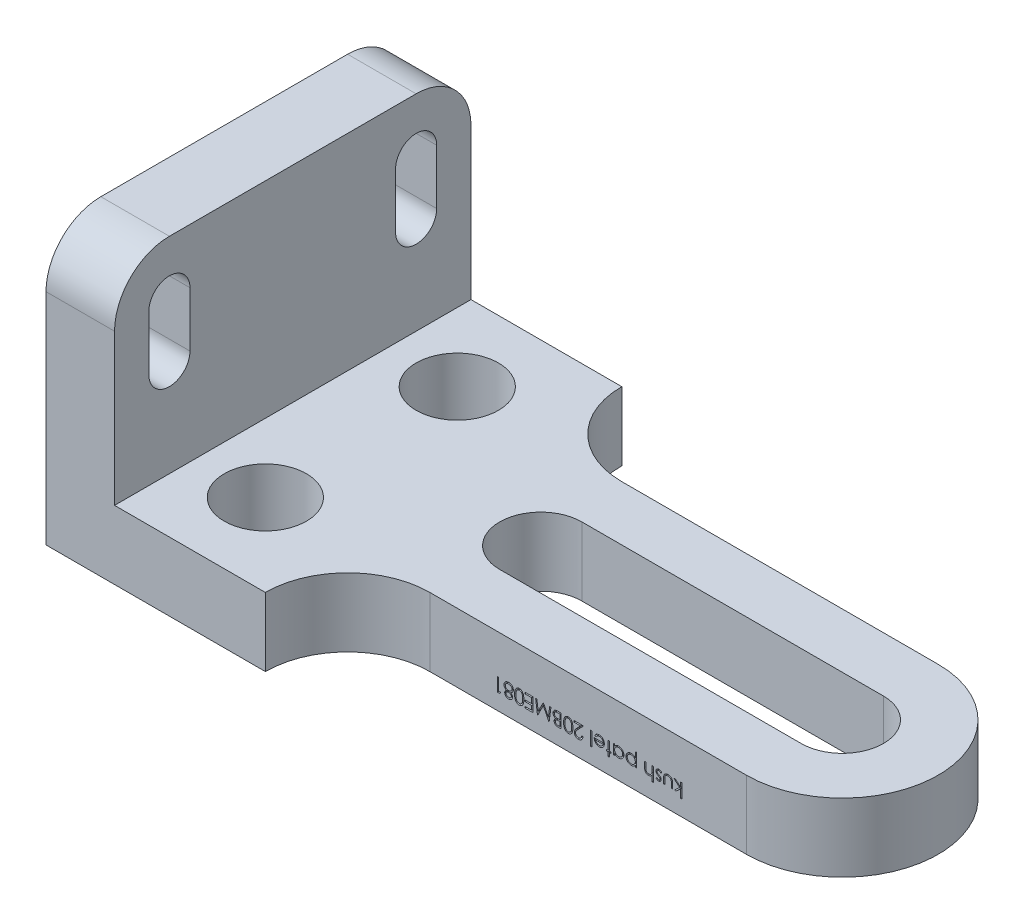
from build123d import *

# Parameters (mm, degrees)
SKETCH1_R           = 6
BOSS_EXTRUDE1_DEPTH = 10
SKETCH1_3_W         = 10
SKETCH1_3_H         = 52
BOSS_EXTRUDE2_DEPTH = 40
CUT_EXTRUDE1_DEPTH  = 10
FILLET1_R           = 8
FILLET2_R           = 8
SKETCH3_W           = 0.179487179
SKETCH3_H           = 2.051282051
CUT_EXTRUDE2_DEPTH  = 3


with BuildPart() as part:
    # Sketch1 → Boss-Extrude1 (new body)
    with BuildSketch(Plane(origin=(0, 0, 0), x_dir=(1, 0, 0), z_dir=(0, 1, 0))):
        with BuildLine():
            Line((10, 52), (10, 0))
            Line((10, 0), (32, 0))
            ThreePointArc((32, 0), (35.514718626, 8.485281374), (44, 12))
            Line((44, 12), (90.176790276, 12))
            ThreePointArc((90.176790276, 12), (104.176790276, 26), (90.176790276, 40))
            Line((90.176790276, 40), (44, 40))
            ThreePointArc((44, 40), (35.514718626, 43.514718626), (32, 52))
            Line((32, 52), (10, 52))
        make_face()
        with Locations((20, 12)):
            Circle(SKETCH1_R, mode=Mode.SUBTRACT)
        with Locations((20, 40)):
            Circle(SKETCH1_R, mode=Mode.SUBTRACT)
        with BuildLine():
            Line((46.176790276, 32), (90.176790276, 32))
            ThreePointArc((90.176790276, 32), (96.176790276, 26), (90.176790276, 20))
            Line((90.176790276, 20), (46.176790276, 20))
            ThreePointArc((46.176790276, 20), (40.176790276, 26), (46.176790276, 32))
        make_face(mode=Mode.SUBTRACT)
    extrude(amount=BOSS_EXTRUDE1_DEPTH)

    # Sketch1<3> → Boss-Extrude2 (add)
    with BuildSketch(Plane(origin=(0, 0, 0), x_dir=(1, 0, 0), z_dir=(0, 1, 0))):
        with Locations((5, 26)):
            Rectangle(SKETCH1_3_W, SKETCH1_3_H)
    extrude(amount=BOSS_EXTRUDE2_DEPTH)

    # Sketch2 → Cut-Extrude1 (cut)
    with BuildSketch(Plane(origin=(10, 0, 0), x_dir=(0, 0, -1), z_dir=(1, 0, 0))):
        Polygon((10.961802059, 49.253763915), (5, 48.577808145), (5, 56.577808145), (10.961802059, 57.228475347), align=None)
        with BuildLine():
            Line((11, 32), (11, 24))
            ThreePointArc((11, 24), (8, 21), (5, 24))
            Line((5, 24), (5, 32))
            ThreePointArc((5, 32), (8, 35), (11, 32))
        make_face()
        with BuildLine():
            Line((41, 31.996165758), (41, 24))
            ThreePointArc((41, 24), (44, 21), (47, 24))
            Line((47, 24), (47, 31.996165758))
            ThreePointArc((47, 31.996165758), (44, 34.996165758), (41, 31.996165758))
        make_face()
    extrude(amount=-CUT_EXTRUDE1_DEPTH, mode=Mode.SUBTRACT)

    # Fillet1
    fillet1_edges = [part.edges().sort_by_distance(p)[0] for p in [
        (5, 40, 0),
    ]]
    fillet(fillet1_edges, radius=FILLET1_R)

    # Fillet2
    fillet2_edges = [part.edges().sort_by_distance(p)[0] for p in [
        (5, 40, -52),
    ]]
    fillet(fillet2_edges, radius=FILLET2_R)

    # Sketch3 → Cut-Extrude2 (cut)
    # profile 1 of 17: a face of its own
    with BuildSketch(Plane.XY.offset(-12)):
        Polygon((80.767882318, 2.282051282), (80.588395138, 2.282051282), (80.588395138, 3.467948718), (79.923331035, 2.871794872), (79.665318215, 2.871794872), (80.43695283, 3.564102564), (79.588395138, 4.333333333), (79.846007318, 4.333333333), (80.588395138, 3.659855769), (80.588395138, 4.333333333), (80.767882318, 4.333333333), align=None)
    # profile 2 of 17: a face of its own
    with BuildSketch(Plane.XY.offset(-12)):
        with BuildLine():
            Line((79.408907959, 2.871794872), (79.229420779, 2.871794872))
            Line((79.229420779, 2.871794872), (79.229420779, 3.549679487))
            add(Edge.make_bspline(
                [(79.229420779, 3.549679487), (79.229339691, 3.569578201), (79.229184572, 3.607643508), (79.228132606, 3.662417901), (79.225658267, 3.712370308), (79.222564653, 3.757529586), (79.218586289, 3.797888096), (79.21385294, 3.833304871), (79.208562414, 3.864181548), (79.20338372, 3.882777751), (79.200975266, 3.891426282)],
                knots=[0, 0, 0, 0, 1.388932606, 2.656963016, 3.823490214, 4.879454478, 5.816252168, 6.653371382, 7.373723809, 8, 8, 8, 8], degree=3))
            add(Edge.make_bspline(
                [(79.200975266, 3.891426282), (79.197111552, 3.902296464), (79.18946445, 3.923810839), (79.175594256, 3.95489071), (79.158433836, 3.983674949), (79.13966188, 4.011283354), (79.117985845, 4.036861518), (79.093722674, 4.060576503), (79.067303033, 4.08270495), (79.028603491, 4.109393627), (78.975700736, 4.137637648), (78.906399789, 4.162347636), (78.831121207, 4.176898148), (78.779031148, 4.178608218), (78.752257318, 4.179487179)],
                knots=[0, 0, 0, 0, 0.725930277, 1.436768641, 2.137297926, 2.832005607, 3.535753883, 4.242956221, 4.964984144, 5.701683124, 7.198126434, 8.723945959, 10.316137162, 12, 12, 12, 12], degree=3))
            add(Edge.make_bspline(
                [(78.752257318, 4.179487179), (78.725480094, 4.178611501), (78.673802401, 4.176921519), (78.599310371, 4.162567321), (78.531090303, 4.139149629), (78.469938729, 4.106002762), (78.416239534, 4.065592425), (78.37149528, 4.01815533), (78.33457656, 3.965213717), (78.318456929, 3.92571401), (78.310350266, 3.905849359)],
                knots=[0, 0, 0, 0, 1.157091467, 2.233085092, 3.266839029, 4.264239195, 5.228693433, 6.160074799, 7.074690074, 8, 8, 8, 8], degree=3))
            add(Edge.make_bspline(
                [(78.310350266, 3.905849359), (78.307951791, 3.897868786), (78.302649346, 3.88022569), (78.296993051, 3.850290916), (78.291686872, 3.814627333), (78.288149296, 3.772860408), (78.284111835, 3.725358459), (78.282717689, 3.671875833), (78.280726776, 3.612727776), (78.280711048, 3.571316594), (78.28070283, 3.549679487)],
                knots=[0, 0, 0, 0, 0.557560243, 1.232629526, 2.036798082, 2.970922211, 4.03790722, 5.227863888, 6.551574656, 8, 8, 8, 8], degree=3))
            Line((78.28070283, 3.549679487), (78.28070283, 2.871794872))
            Line((78.28070283, 2.871794872), (78.101215651, 2.871794872))
            Line((78.101215651, 2.871794872), (78.101215651, 3.583333333))
            add(Edge.make_bspline(
                [(78.101215651, 3.583333333), (78.101468954, 3.607508726), (78.101960397, 3.654412293), (78.105095123, 3.72257647), (78.110548577, 3.786223358), (78.11861234, 3.84515812), (78.128394798, 3.899394852), (78.140764804, 3.948950619), (78.155613649, 3.993894341), (78.172369082, 4.034881779), (78.192114511, 4.072079738), (78.213259036, 4.107187269), (78.237033985, 4.140088632), (78.262963988, 4.171084839), (78.291799552, 4.199423711), (78.322034863, 4.226558249), (78.355146382, 4.250814434), (78.390018246, 4.273484386), (78.427529594, 4.2936024), (78.467357787, 4.311009956), (78.509460694, 4.326134182), (78.553904072, 4.337821408), (78.60066186, 4.347681496), (78.649674354, 4.354244215), (78.701034829, 4.358434444), (78.735955855, 4.358791365), (78.753859882, 4.358974359)],
                knots=[0, 0, 0, 0, 1.493120159, 2.896857355, 4.213387119, 5.437035652, 6.569467867, 7.615715674, 8.588612823, 9.490833737, 10.346735778, 11.186995163, 12.020221603, 12.851363391, 13.679553205, 14.515225522, 15.358192885, 16.211587453, 17.082499898, 17.983626775, 18.894104459, 19.842498226, 20.819547185, 21.843713668, 22.894470975, 24, 24, 24, 24], degree=3))
            add(Edge.make_bspline(
                [(78.753859882, 4.358974359), (78.771629413, 4.358780512), (78.806548196, 4.358399585), (78.857787568, 4.354314709), (78.90690586, 4.347580971), (78.953700458, 4.337900445), (78.998359971, 4.326039979), (79.040667581, 4.31111629), (79.080676713, 4.293502792), (79.11847345, 4.273465588), (79.153932395, 4.250896951), (79.186973849, 4.226057641), (79.218186855, 4.199595742), (79.246704983, 4.170608778), (79.272737399, 4.139313771), (79.296396962, 4.105851352), (79.318088346, 4.070599716), (79.337718005, 4.032848751), (79.354582012, 3.9913792), (79.36947068, 3.945495094), (79.381648201, 3.894693671), (79.391558179, 3.839018279), (79.399530432, 3.778735399), (79.40506537, 3.713496304), (79.40816013, 3.643459909), (79.408653308, 3.595088543), (79.408907959, 3.570112179)],
                knots=[0, 0, 0, 0, 1.083759936, 2.129689164, 3.133164553, 4.10615121, 5.04285688, 5.949793092, 6.839814394, 7.707177441, 8.556916231, 9.400895077, 10.227072161, 11.05083587, 11.877976332, 12.707560346, 13.548664154, 14.401248865, 15.299878211, 16.27626931, 17.341250723, 18.483766318, 19.724630785, 21.049282549, 22.476408703, 24, 24, 24, 24], degree=3))
            Line((79.408907959, 3.570112179), (79.408907959, 2.871794872))
        make_face()
    # profile 3 of 17: a face of its own
    with BuildSketch(Plane.XY.offset(-12)):
        with BuildLine():
            Line((76.998651548, 3.054086538), (77.12044642, 3.179487179))
            add(Edge.make_bspline(
                [(77.12044642, 3.179487179), (77.130953555, 3.167305606), (77.151210075, 3.143820965), (77.183365353, 3.112463487), (77.215385787, 3.085910326), (77.247102493, 3.064061618), (77.27857466, 3.046866483), (77.310070998, 3.03472174), (77.341505078, 3.027097315), (77.362527357, 3.026120625), (77.372850266, 3.025641026)],
                knots=[0, 0, 0, 0, 1.265880991, 2.440469525, 3.530740057, 4.536711111, 5.468008477, 6.34654737, 7.188078389, 8, 8, 8, 8], degree=3))
            add(Edge.make_bspline(
                [(77.372850266, 3.025641026), (77.385496437, 3.026262828), (77.410382311, 3.027486448), (77.446014087, 3.039404112), (77.478688367, 3.058218259), (77.507604351, 3.083870833), (77.531746839, 3.114270145), (77.549842155, 3.147974328), (77.560670441, 3.184442762), (77.562052929, 3.209597533), (77.562754112, 3.222355769)],
                knots=[0, 0, 0, 0, 0.999905305, 1.967672129, 2.944835807, 3.972828834, 5.013019963, 6.007753697, 6.989553527, 8, 8, 8, 8], degree=3))
            add(Edge.make_bspline(
                [(77.562754112, 3.222355769), (77.562119363, 3.233905509), (77.560851652, 3.256972429), (77.550996407, 3.290999877), (77.535301509, 3.324175328), (77.520632826, 3.344496988), (77.513074625, 3.354967949)],
                knots=[0, 0, 0, 0, 0.960159726, 1.917612774, 2.927026955, 4, 4, 4, 4], degree=3))
            add(Edge.make_bspline(
                [(77.513074625, 3.354967949), (77.508500649, 3.360534374), (77.498706571, 3.372453547), (77.480941878, 3.389416152), (77.459897795, 3.407152884), (77.435374526, 3.42554341), (77.407322782, 3.444606995), (77.376153657, 3.464667473), (77.341481926, 3.485137625), (77.317064129, 3.498596109), (77.304340651, 3.505608974)],
                knots=[0, 0, 0, 0, 0.667332049, 1.428932371, 2.272176193, 3.217953793, 4.268659351, 5.415594948, 6.6533338, 8, 8, 8, 8], degree=3))
            add(Edge.make_bspline(
                [(77.304340651, 3.505608974), (77.288787252, 3.514316684), (77.258743207, 3.531137112), (77.216099081, 3.557306241), (77.177168621, 3.583141647), (77.142489356, 3.609234024), (77.111248123, 3.634510077), (77.083946938, 3.659668547), (77.060501246, 3.68477593), (77.047387589, 3.702341265), (77.041119497, 3.710737179)],
                knots=[0, 0, 0, 0, 1.271974443, 2.457035787, 3.569878245, 4.604907449, 5.553098313, 6.436573686, 7.252710343, 8, 8, 8, 8], degree=3))
            add(Edge.make_bspline(
                [(77.041119497, 3.710737179), (77.030645933, 3.727665373), (77.009761501, 3.761420426), (76.989046255, 3.817313796), (76.975429889, 3.875948204), (76.97382742, 3.916186352), (76.973010523, 3.936698718)],
                knots=[0, 0, 0, 0, 0.995678878, 1.985397446, 2.973007791, 4, 4, 4, 4], degree=3))
            add(Edge.make_bspline(
                [(76.973010523, 3.936698718), (76.973420775, 3.951138673), (76.974229221, 3.97959418), (76.979875466, 4.021493448), (76.989515995, 4.06159368), (77.002869466, 4.100137258), (77.020025434, 4.137020338), (77.041411226, 4.171981738), (77.06664445, 4.205014514), (77.094742292, 4.236551834), (77.126121838, 4.265206771), (77.159997946, 4.290020019), (77.195348664, 4.311606919), (77.232951048, 4.328773177), (77.272332663, 4.342569152), (77.31371774, 4.352078867), (77.356932212, 4.357780781), (77.386320944, 4.358571469), (77.401295779, 4.358974359)],
                knots=[0, 0, 0, 0, 1.032810722, 2.035266353, 3.017676364, 3.978389067, 4.948507077, 5.921677479, 6.903715858, 7.918386526, 8.939467451, 9.936812204, 10.918153393, 11.89693397, 12.887853058, 13.89815236, 14.929017384, 16, 16, 16, 16], degree=3))
            add(Edge.make_bspline(
                [(77.401295779, 4.358974359), (77.421506597, 4.358409671), (77.461647404, 4.357288141), (77.520998157, 4.346675334), (77.579115245, 4.330352154), (77.635163625, 4.307079784), (77.688287067, 4.278468539), (77.73717956, 4.24461679), (77.781332409, 4.205703477), (77.806553716, 4.175939621), (77.819164369, 4.161057692)],
                knots=[0, 0, 0, 0, 1.014105853, 2.01412079, 3.018242674, 4.040740662, 5.055023907, 6.042888753, 7.021444376, 8, 8, 8, 8], degree=3))
            Line((77.819164369, 4.161057692), (77.700173984, 4.025641026))
            add(Edge.make_bspline(
                [(77.700173984, 4.025641026), (77.688875463, 4.037843748), (77.66697157, 4.061500571), (77.631942303, 4.093000194), (77.596296931, 4.119400921), (77.560391396, 4.141482872), (77.523694199, 4.158497388), (77.486410991, 4.17045087), (77.448617606, 4.178133266), (77.423233528, 4.179035141), (77.410510523, 4.179487179)],
                knots=[0, 0, 0, 0, 1.179806542, 2.287233372, 3.337373186, 4.324005949, 5.273901747, 6.200048787, 7.097828587, 8, 8, 8, 8], degree=3))
            add(Edge.make_bspline(
                [(77.410510523, 4.179487179), (77.393186122, 4.178703781), (77.359337148, 4.177173152), (77.310853199, 4.163278653), (77.266095018, 4.141486432), (77.227198828, 4.110594894), (77.194282617, 4.074654867), (77.169967534, 4.034318604), (77.155234345, 3.990307149), (77.153417997, 3.959778789), (77.152497702, 3.944310897)],
                knots=[0, 0, 0, 0, 1.072236613, 2.094970478, 3.102399718, 4.141104368, 5.155589565, 6.110053346, 7.042415349, 8, 8, 8, 8], degree=3))
            add(Edge.make_bspline(
                [(77.152497702, 3.944310897), (77.153099277, 3.931556864), (77.154280894, 3.906505302), (77.164139312, 3.870160097), (77.179050096, 3.835486351), (77.194132237, 3.815179998), (77.201776548, 3.804887821)],
                knots=[0, 0, 0, 0, 1.014054094, 1.991812201, 2.982159616, 4, 4, 4, 4], degree=3))
            add(Edge.make_bspline(
                [(77.201776548, 3.804887821), (77.206359782, 3.799723341), (77.216343719, 3.788473238), (77.234680448, 3.772258091), (77.25646129, 3.754668769), (77.282653656, 3.73676934), (77.31193606, 3.716940304), (77.345872482, 3.697276294), (77.383147615, 3.675829984), (77.409536633, 3.661656), (77.423331035, 3.654246795)],
                knots=[0, 0, 0, 0, 0.615029206, 1.339755737, 2.178261527, 3.109653826, 4.166232585, 5.329982127, 6.604294388, 8, 8, 8, 8], degree=3))
            add(Edge.make_bspline(
                [(77.423331035, 3.654246795), (77.43821483, 3.64593872), (77.467079257, 3.62982671), (77.507963423, 3.604731807), (77.544847626, 3.57920765), (77.578619382, 3.554686028), (77.608425671, 3.52987406), (77.63414907, 3.504744202), (77.656802337, 3.480309924), (77.669343715, 3.462997183), (77.675334241, 3.454727564)],
                knots=[0, 0, 0, 0, 1.262093308, 2.447601706, 3.550203992, 4.582594899, 5.537233252, 6.418365656, 7.244515135, 8, 8, 8, 8], degree=3))
            add(Edge.make_bspline(
                [(77.675334241, 3.454727564), (77.685679568, 3.438067724), (77.706307843, 3.404848503), (77.726692894, 3.34933279), (77.740318433, 3.290729407), (77.741592157, 3.250214915), (77.742241292, 3.229567308)],
                knots=[0, 0, 0, 0, 0.984940175, 1.963941237, 2.962352981, 4, 4, 4, 4], degree=3))
            add(Edge.make_bspline(
                [(77.742241292, 3.229567308), (77.741936398, 3.216066933), (77.741339678, 3.189644787), (77.736566569, 3.150824678), (77.727904128, 3.113932449), (77.716912369, 3.078341972), (77.701954937, 3.044707546), (77.683821347, 3.012679405), (77.662106891, 2.982776578), (77.637673211, 2.954794066), (77.611124668, 2.929095482), (77.582019545, 2.907112521), (77.55157068, 2.888048135), (77.519112009, 2.872779339), (77.485058122, 2.860644704), (77.449143758, 2.85242534), (77.411617263, 2.846896583), (77.385958699, 2.846404991), (77.372850266, 2.846153846)],
                knots=[0, 0, 0, 0, 1.087410352, 2.12821612, 3.143409386, 4.13688077, 5.124334423, 6.102425883, 7.096654197, 8.095527921, 9.09231389, 10.067027194, 11.028349958, 11.981147348, 12.950860869, 13.934615631, 14.944837612, 16, 16, 16, 16], degree=3))
            add(Edge.make_bspline(
                [(77.372850266, 2.846153846), (77.357311182, 2.846783421), (77.325941516, 2.84805438), (77.278893624, 2.858194961), (77.231968332, 2.87470913), (77.185117547, 2.898052925), (77.138141663, 2.927413977), (77.091251244, 2.963553431), (77.043684466, 3.005451165), (77.013997921, 3.037512517), (76.998651548, 3.054086538)],
                knots=[0, 0, 0, 0, 0.845753203, 1.707371858, 2.609134499, 3.549244224, 4.552329203, 5.621587647, 6.770486714, 8, 8, 8, 8], degree=3))
        make_face()
    # profile 4 of 17: a face of its own
    with BuildSketch(Plane.XY.offset(-12)):
        with BuildLine():
            Line((76.614036164, 2.282051282), (76.434548984, 2.282051282))
            Line((76.434548984, 2.282051282), (76.434548984, 3.147836538))
            add(Edge.make_bspline(
                [(76.434548984, 3.147836538), (76.415251277, 3.123787749), (76.377737271, 3.077037822), (76.315025344, 3.015381184), (76.249679057, 2.962864392), (76.181143859, 2.919979395), (76.109711027, 2.886711055), (76.035205031, 2.863436333), (75.95781582, 2.848922734), (75.905098391, 2.847083332), (75.878459241, 2.846153846)],
                knots=[0, 0, 0, 0, 1.12556596, 2.18805719, 3.205172764, 4.182516927, 5.13416184, 6.075333115, 7.027428072, 8, 8, 8, 8], degree=3))
            add(Edge.make_bspline(
                [(75.878459241, 2.846153846), (75.851400257, 2.847094766), (75.798412752, 2.848937297), (75.721540863, 2.865172324), (75.649242447, 2.890864535), (75.582483268, 2.926973042), (75.522294172, 2.971806323), (75.470089867, 3.024388039), (75.426296237, 3.084025639), (75.396995054, 3.139614845), (75.377791003, 3.189049727), (75.365651623, 3.23147431), (75.355353557, 3.278742839), (75.346382703, 3.33083732), (75.340403385, 3.388005883), (75.335600785, 3.449991203), (75.332185656, 3.516789547), (75.332053313, 3.563029691), (75.331984882, 3.586939103)],
                knots=[0, 0, 0, 0, 1.235689485, 2.419754739, 3.574485241, 4.732583367, 5.875375667, 6.993392835, 8.106934443, 9.24564317, 9.854426656, 10.528623913, 11.260290605, 12.06517837, 12.94359002, 13.886555271, 14.907200199, 16, 16, 16, 16], degree=3))
            Line((75.331984882, 3.586939103), (75.331984882, 4.333333333))
            Line((75.331984882, 4.333333333), (75.511472061, 4.333333333))
            Line((75.511472061, 4.333333333), (75.511472061, 3.645833333))
            add(Edge.make_bspline(
                [(75.511472061, 3.645833333), (75.511580371, 3.625934639), (75.511787549, 3.587871825), (75.512480817, 3.533377237), (75.51399321, 3.484083091), (75.516527518, 3.439887058), (75.519077625, 3.400849034), (75.522693012, 3.366905255), (75.526868034, 3.33826866), (75.530621865, 3.321031745), (75.532305394, 3.313301282)],
                knots=[0, 0, 0, 0, 1.430934443, 2.737134061, 3.918973087, 4.976914145, 5.92044225, 6.731742364, 7.431207999, 8, 8, 8, 8], degree=3))
            add(Edge.make_bspline(
                [(75.532305394, 3.313301282), (75.538803227, 3.290602194), (75.55126227, 3.247078619), (75.580799527, 3.18806354), (75.616832874, 3.137290646), (75.661495822, 3.09620204), (75.713304651, 3.063826738), (75.772751216, 3.041769428), (75.8390759, 3.02770324), (75.88572651, 3.026348909), (75.910109882, 3.025641026)],
                knots=[0, 0, 0, 0, 1.090171874, 2.090312098, 3.036871164, 3.954896932, 4.878889889, 5.844924892, 6.87358393, 8, 8, 8, 8], degree=3))
            add(Edge.make_bspline(
                [(75.910109882, 3.025641026), (75.924549893, 3.025909013), (75.953126302, 3.026439352), (75.99547825, 3.031898648), (76.036689193, 3.04052087), (76.076648523, 3.05325666), (76.115437751, 3.068740973), (76.153214552, 3.087743323), (76.189461925, 3.110719208), (76.224647721, 3.136578339), (76.257402237, 3.165185374), (76.28787445, 3.195384735), (76.315039327, 3.22754157), (76.339649921, 3.261141712), (76.360894663, 3.296645574), (76.379439279, 3.333710904), (76.395173964, 3.372386414), (76.402992645, 3.399229307), (76.406904753, 3.412660256)],
                knots=[0, 0, 0, 0, 1.024369801, 2.02720137, 3.025498567, 4.008789058, 4.999724648, 5.987391013, 7.005161842, 8.042127274, 9.083588116, 10.088924978, 11.084112559, 12.068088063, 13.041783903, 14.016724555, 15.007660144, 16, 16, 16, 16], degree=3))
            add(Edge.make_bspline(
                [(76.406904753, 3.412660256), (76.409155855, 3.422386514), (76.414061281, 3.443581227), (76.419384043, 3.478537983), (76.424148499, 3.519158767), (76.428176241, 3.565381967), (76.430646576, 3.617376963), (76.433308428, 3.67478894), (76.434299293, 3.737977523), (76.434463266, 3.781917813), (76.434548984, 3.804887821)],
                knots=[0, 0, 0, 0, 0.607992626, 1.324890765, 2.152360218, 3.099583803, 4.150613268, 5.323148443, 6.60066238, 8, 8, 8, 8], degree=3))
            Line((76.434548984, 3.804887821), (76.434548984, 4.333333333))
            Line((76.434548984, 4.333333333), (76.614036164, 4.333333333))
            Line((76.614036164, 4.333333333), (76.614036164, 2.282051282))
        make_face()
    # profile 5 of 17: a face of its own
    with BuildSketch(Plane.XY.offset(-12)):
        with BuildLine():
            Line((74.152497702, 2.871794872), (73.973010523, 2.871794872))
            Line((73.973010523, 2.871794872), (73.973010523, 3.142227564))
            add(Edge.make_bspline(
                [(73.973010523, 3.142227564), (73.953889485, 3.117886643), (73.916613618, 3.070434774), (73.853343144, 3.008065675), (73.785045759, 2.956915277), (73.712860331, 2.915447785), (73.636075916, 2.884666976), (73.555553205, 2.861987567), (73.470386818, 2.848587481), (73.412160465, 2.846975791), (73.382465651, 2.846153846)],
                knots=[0, 0, 0, 0, 1.079470681, 2.104394496, 3.089609837, 4.049760214, 5.000876222, 5.968810619, 6.964115249, 8, 8, 8, 8], degree=3))
            add(Edge.make_bspline(
                [(73.382465651, 2.846153846), (73.356527592, 2.846904234), (73.305259656, 2.848387415), (73.229794953, 2.858429161), (73.157123306, 2.875639271), (73.087655846, 2.900439794), (73.020648381, 2.931100062), (72.957092895, 2.969795511), (72.895999435, 3.014599049), (72.838904469, 3.066160278), (72.786149402, 3.121947859), (72.740523013, 3.181960604), (72.701167639, 3.244224939), (72.669356041, 3.309706135), (72.644436985, 3.377888552), (72.626714313, 3.449047661), (72.616167088, 3.522919627), (72.614751972, 3.573149753), (72.614036164, 3.598557692)],
                knots=[0, 0, 0, 0, 1.041296284, 2.058176809, 3.050446431, 4.034000596, 5.01514041, 6.003636468, 7.015969324, 8.052561599, 9.08815499, 10.094063707, 11.074456064, 12.040834395, 13.011057502, 13.983766392, 14.980127149, 16, 16, 16, 16], degree=3))
            add(Edge.make_bspline(
                [(72.614036164, 3.598557692), (72.614732548, 3.624503353), (72.61610592, 3.67567194), (72.626873236, 3.750786114), (72.643796267, 3.823186816), (72.669162559, 3.892185024), (72.700219477, 3.958779027), (72.739078366, 4.021843379), (72.784672474, 4.081979288), (72.836860639, 4.138172343), (72.893455326, 4.1899516), (72.953968137, 4.235207095), (73.017496197, 4.273376411), (73.083735831, 4.304814387), (73.152918463, 4.329044711), (73.225006787, 4.346197799), (73.300016427, 4.356869195), (73.351046851, 4.358267257), (73.376856677, 4.358974359)],
                knots=[0, 0, 0, 0, 1.038787011, 2.048637893, 3.033314735, 4.011256821, 4.987456671, 5.971770257, 6.972013799, 8.005388554, 9.039095487, 10.040396776, 11.026510796, 12.002710647, 12.972028308, 13.95670515, 14.966556032, 16, 16, 16, 16], degree=3))
            add(Edge.make_bspline(
                [(73.376856677, 4.358974359), (73.406027484, 4.358198276), (73.463364542, 4.356672835), (73.547503612, 4.342483705), (73.628019644, 4.319870931), (73.70471524, 4.287218852), (73.778125427, 4.246416494), (73.847210351, 4.195487029), (73.91348659, 4.136766046), (73.952923125, 4.091543948), (73.973010523, 4.068509615)],
                knots=[0, 0, 0, 0, 1.019216655, 2.003334536, 2.974394125, 3.93700843, 4.911195144, 5.904014639, 6.932388669, 8, 8, 8, 8], degree=3))
            Line((73.973010523, 4.068509615), (73.973010523, 4.871794872))
            Line((73.973010523, 4.871794872), (74.152497702, 4.871794872))
            Line((74.152497702, 4.871794872), (74.152497702, 2.871794872))
        make_face()
        with BuildLine():
            add(Edge.make_bspline(
                [(73.384068215, 3.025641026), (73.404399123, 3.026007432), (73.44442544, 3.026728793), (73.503099147, 3.035277548), (73.559596644, 3.047727658), (73.613317407, 3.06639003), (73.664698571, 3.089842185), (73.713829283, 3.118178627), (73.759883306, 3.152672478), (73.803406279, 3.191316171), (73.84316782, 3.23368364), (73.877970934, 3.279314047), (73.907255372, 3.327579053), (73.931536106, 3.378227633), (73.950019631, 3.431623455), (73.963136732, 3.487471299), (73.971382772, 3.54582988), (73.972462148, 3.585576185), (73.973010523, 3.605769231)],
                knots=[0, 0, 0, 0, 1.056783697, 2.080534709, 3.078213817, 4.062450963, 5.032388505, 6.013014931, 7.006476528, 8.020136409, 9.037574406, 10.02408906, 10.99988041, 11.969394914, 12.94050107, 13.932990591, 14.949859205, 16, 16, 16, 16], degree=3))
            add(Edge.make_bspline(
                [(73.973010523, 3.605769231), (73.972085727, 3.632271622), (73.970273974, 3.684192052), (73.956033972, 3.760057866), (73.931689171, 3.831515727), (73.898357158, 3.898669741), (73.856411129, 3.960510556), (73.805517864, 4.015684631), (73.746552418, 4.064002903), (73.680242693, 4.104861667), (73.609050803, 4.137840977), (73.535051309, 4.162204757), (73.458750132, 4.176664036), (73.407232392, 4.178541036), (73.381263728, 4.179487179)],
                knots=[0, 0, 0, 0, 1.03769607, 2.032934487, 3.010626162, 3.986202239, 4.961259226, 5.927576439, 6.916221152, 7.938198981, 8.97036853, 9.982809098, 10.983189979, 12, 12, 12, 12], degree=3))
            add(Edge.make_bspline(
                [(73.381263728, 4.179487179), (73.355814758, 4.178597788), (73.305303127, 4.176832506), (73.230926468, 4.16155403), (73.15864836, 4.138212147), (73.089965391, 4.104185225), (73.025526976, 4.062449992), (72.967113548, 4.012448639), (72.916601381, 3.95393472), (72.872610675, 3.889608251), (72.837753271, 3.820386914), (72.811925017, 3.748787375), (72.796729008, 3.675184454), (72.794593296, 3.625467959), (72.793523343, 3.600560897)],
                knots=[0, 0, 0, 0, 1.001026069, 1.986856787, 2.977862212, 3.984342003, 4.995015878, 5.994217425, 7.000312571, 8.029930354, 9.055188864, 10.043064731, 11.019610969, 12, 12, 12, 12], degree=3))
            add(Edge.make_bspline(
                [(72.793523343, 3.600560897), (72.794358165, 3.575502945), (72.796021304, 3.525582268), (72.812281002, 3.451973004), (72.836980584, 3.380212477), (72.871885011, 3.311542594), (72.91536465, 3.247839951), (72.965922512, 3.190353526), (73.024065048, 3.141140593), (73.087999495, 3.099370456), (73.157292782, 3.066770275), (73.23001262, 3.042792804), (73.30604593, 3.028419504), (73.357832015, 3.026575332), (73.384068215, 3.025641026)],
                knots=[0, 0, 0, 0, 0.983964174, 1.960262275, 2.950024098, 3.962167997, 4.978769863, 5.975637987, 6.962679854, 7.964734575, 8.970044757, 9.964711476, 10.968869031, 12, 12, 12, 12], degree=3))
        make_face(mode=Mode.SUBTRACT)
    # profile 6 of 17: a face of its own
    with BuildSketch(Plane.XY.offset(-12)):
        with BuildLine():
            Line((70.767882318, 2.871794872), (70.767882318, 4.333333333))
            Line((70.767882318, 4.333333333), (70.947369497, 4.333333333))
            Line((70.947369497, 4.333333333), (70.947369497, 4.080528846))
            add(Edge.make_bspline(
                [(70.947369497, 4.080528846), (70.967636226, 4.103377068), (71.007245818, 4.148031967), (71.072767586, 4.206729768), (71.142794409, 4.254653634), (71.216133248, 4.293553529), (71.293351771, 4.322877006), (71.373996478, 4.343535033), (71.458004269, 4.356973373), (71.515293029, 4.35830138), (71.544324625, 4.358974359)],
                knots=[0, 0, 0, 0, 1.074235403, 2.099501444, 3.086304576, 4.053325556, 5.01427503, 5.985443889, 6.979105517, 8, 8, 8, 8], degree=3))
            add(Edge.make_bspline(
                [(71.544324625, 4.358974359), (71.570134955, 4.358273691), (71.621034067, 4.356891943), (71.695906817, 4.346168955), (71.767963255, 4.328957631), (71.837249304, 4.30499154), (71.903295495, 4.273365379), (71.96647398, 4.235093357), (72.026932206, 4.189963882), (72.083520385, 4.138170375), (72.135696088, 4.081974761), (72.181344559, 4.02186251), (72.220033123, 3.958659263), (72.251828195, 3.892382783), (72.276432888, 3.823081518), (72.293551097, 3.750803011), (72.304262531, 3.675667529), (72.305643579, 3.624501869), (72.306343856, 3.598557692)],
                knots=[0, 0, 0, 0, 1.034036272, 2.039165313, 3.024406509, 3.999331371, 4.971254918, 5.953351348, 6.95522652, 7.989525907, 9.023492927, 10.024309745, 11.009187477, 11.988246066, 12.964946762, 13.950187958, 14.960617622, 16, 16, 16, 16], degree=3))
            add(Edge.make_bspline(
                [(72.306343856, 3.598557692), (72.305628047, 3.573149753), (72.304212931, 3.522919629), (72.293665713, 3.449047652), (72.275943013, 3.377888583), (72.251024059, 3.309706019), (72.21921208, 3.244225369), (72.179858159, 3.181958954), (72.134226138, 3.121954272), (72.081492809, 3.066135568), (72.02439673, 3.014762269), (71.963600246, 2.96952312), (71.899861428, 2.931349224), (71.83305247, 2.900317557), (71.763646439, 2.875657906), (71.691116094, 2.858467754), (71.615791274, 2.848362697), (71.564654388, 2.846897204), (71.538715651, 2.846153846)],
                knots=[0, 0, 0, 0, 1.02050356, 2.017480486, 2.990790918, 3.96161403, 4.928589988, 5.909588639, 6.91611943, 7.952353252, 8.989586576, 9.99823133, 10.991940466, 11.968822692, 12.952985106, 13.945868367, 14.958059758, 16, 16, 16, 16], degree=3))
            add(Edge.make_bspline(
                [(71.538715651, 2.846153846), (71.508886565, 2.846972334), (71.450393135, 2.848577349), (71.364715187, 2.862048281), (71.283625547, 2.884595755), (71.206421853, 2.915370734), (71.134189066, 2.956813678), (71.066232783, 3.008092514), (71.003359331, 3.070450409), (70.966355624, 3.117887963), (70.947369497, 3.142227564)],
                knots=[0, 0, 0, 0, 1.038908319, 2.037250181, 3.012632028, 3.966567879, 4.9252131, 5.905168122, 6.925168603, 8, 8, 8, 8], degree=3))
            Line((70.947369497, 3.142227564), (70.947369497, 2.871794872))
            Line((70.947369497, 2.871794872), (70.767882318, 2.871794872))
        make_face()
        with BuildLine():
            add(Edge.make_bspline(
                [(71.536311805, 3.025641026), (71.56254802, 3.026575322), (71.614334137, 3.028419474), (71.690367218, 3.04279292), (71.763087915, 3.066769842), (71.83237797, 3.099372089), (71.89632441, 3.141134561), (71.954422724, 3.190375755), (72.005097967, 3.247698967), (72.04794531, 3.311787189), (72.083516547, 3.380080976), (72.108063462, 3.451992264), (72.124367635, 3.525577436), (72.126024836, 3.575501331), (72.126856677, 3.600560897)],
                knots=[0, 0, 0, 0, 1.031179624, 2.035384561, 3.030098214, 4.035455833, 5.037557836, 6.024646278, 7.02156144, 8.035264006, 9.049836703, 10.039645228, 11.015989397, 12, 12, 12, 12], degree=3))
            add(Edge.make_bspline(
                [(72.126856677, 3.600560897), (72.125776845, 3.625464581), (72.123621413, 3.675174334), (72.10856435, 3.748872273), (72.082134841, 3.820314396), (72.047341711, 3.889488522), (72.003819895, 3.954054773), (71.95324467, 4.012436428), (71.894851553, 4.062436672), (71.830342026, 4.104317184), (71.761515514, 4.13800669), (71.689110539, 4.161768006), (71.614389099, 4.176770692), (71.563491693, 4.178578638), (71.537914369, 4.179487179)],
                knots=[0, 0, 0, 0, 0.979235476, 1.954632679, 2.943119654, 3.967171814, 4.992637064, 5.997548408, 6.995574264, 8.005058949, 9.015076297, 9.999929117, 10.994910263, 12, 12, 12, 12], degree=3))
            add(Edge.make_bspline(
                [(71.537914369, 4.179487179), (71.511945352, 4.178541937), (71.460426914, 4.176666724), (71.384130932, 4.162194152), (71.310226713, 4.13791951), (71.239316122, 4.104864619), (71.173369129, 4.063884593), (71.11445613, 4.015695749), (71.063560965, 3.960510515), (71.021657185, 3.898658637), (70.98817663, 3.831598411), (70.964469858, 3.759971577), (70.950071199, 3.68420377), (70.948282517, 3.632275582), (70.947369497, 3.605769231)],
                knots=[0, 0, 0, 0, 1.017730373, 2.019016736, 3.032373701, 4.060729657, 5.079187105, 6.068726676, 7.03591854, 8.011858086, 8.988317194, 9.965225429, 10.961364673, 12, 12, 12, 12], degree=3))
            add(Edge.make_bspline(
                [(70.947369497, 3.605769231), (70.947917881, 3.585576193), (70.948997273, 3.545829903), (70.957243189, 3.48747121), (70.970360744, 3.431623774), (70.988842619, 3.378226469), (71.013129488, 3.327583404), (71.042390805, 3.27929761), (71.077226764, 3.233818862), (71.116577218, 3.191204755), (71.160135521, 3.152530844), (71.206454131, 3.118443983), (71.255416511, 3.08959712), (71.306988291, 3.066512084), (71.360772264, 3.047705284), (71.417283937, 3.035283717), (71.475953776, 3.026727175), (71.515980626, 3.026006887), (71.536311805, 3.025641026)],
                knots=[0, 0, 0, 0, 1.050062701, 2.066855696, 3.059271411, 4.030305351, 4.999747758, 5.975466543, 6.961907836, 7.974539719, 8.98812422, 9.98710676, 10.961662635, 11.93785114, 12.922015094, 13.919620009, 14.94329489, 16, 16, 16, 16], degree=3))
        make_face(mode=Mode.SUBTRACT)
    # profile 7 of 17: a face of its own
    with BuildSketch(Plane.XY.offset(-12)):
        Polygon((70.178138728, 2.282051282), (69.998651548, 2.282051282), (69.998651548, 2.871794872), (69.742241292, 2.871794872), (69.742241292, 3.051282051), (69.998651548, 3.051282051), (69.998651548, 4.333333333), (70.178138728, 4.333333333), (70.178138728, 3.051282051), (70.434548984, 3.051282051), (70.434548984, 2.871794872), (70.178138728, 2.871794872), align=None)
    # profile 8 of 17: a face of its own
    with BuildSketch(Plane.XY.offset(-12)):
        with BuildLine():
            Line((68.209388728, 3.871794872), (68.0499336, 3.955528846))
            add(Edge.make_bspline(
                [(68.0499336, 3.955528846), (68.062648722, 3.978060704), (68.087387316, 4.021898776), (68.129726091, 4.082160719), (68.174569631, 4.135864711), (68.222809107, 4.182758637), (68.273839368, 4.223944113), (68.328420358, 4.259233995), (68.385643885, 4.289873913), (68.446339959, 4.314847118), (68.510450667, 4.334503753), (68.57837097, 4.349013994), (68.650415166, 4.357430058), (68.699751188, 4.358451387), (68.725013728, 4.358974359)],
                knots=[0, 0, 0, 0, 1.120547187, 2.180141081, 3.186367408, 4.148075574, 5.090720713, 6.023293347, 6.960451315, 7.899733127, 8.862572377, 9.862522039, 10.90550313, 12, 12, 12, 12], degree=3))
            add(Edge.make_bspline(
                [(68.725013728, 4.358974359), (68.753094858, 4.35831883), (68.807873007, 4.357040083), (68.887610008, 4.346015819), (68.962683952, 4.32803161), (69.033090671, 4.302908456), (69.098657561, 4.270092798), (69.159515604, 4.230116117), (69.215982348, 4.18318277), (69.266287805, 4.128890052), (69.311548099, 4.070777202), (69.351584956, 4.010263057), (69.384669355, 3.947373133), (69.412908198, 3.883062263), (69.433802435, 3.816474532), (69.449401923, 3.748196611), (69.458142396, 3.677978466), (69.459503896, 3.630497856), (69.46019001, 3.606570513)],
                knots=[0, 0, 0, 0, 1.145213001, 2.233978795, 3.276616913, 4.289988888, 5.2768102, 6.260573508, 7.254647871, 8.264498533, 9.273731702, 10.25749501, 11.220258744, 12.169609138, 13.119022067, 14.062790212, 15.023763961, 16, 16, 16, 16], degree=3))
            add(Edge.make_bspline(
                [(69.46019001, 3.606570513), (69.459584786, 3.584116324), (69.458385313, 3.539615087), (69.450824863, 3.473749062), (69.437425838, 3.409732803), (69.419039368, 3.347513118), (69.395295798, 3.287194185), (69.366248816, 3.228739291), (69.331853171, 3.17221064), (69.305297358, 3.136551706), (69.291920779, 3.118589744)],
                knots=[0, 0, 0, 0, 1.024358464, 2.0301432, 3.019427413, 4.004406732, 4.986367066, 5.972626655, 6.978780325, 8, 8, 8, 8], degree=3))
            add(Edge.make_bspline(
                [(69.291920779, 3.118589744), (69.27383334, 3.09691451), (69.238289524, 3.054320283), (69.177548518, 2.998863241), (69.11266293, 2.951424482), (69.042980087, 2.912723849), (68.968617368, 2.882956943), (68.889958329, 2.861784137), (68.806785558, 2.84860945), (68.749769714, 2.846984825), (68.720606677, 2.846153846)],
                knots=[0, 0, 0, 0, 1.030811313, 2.025658015, 2.997072178, 3.962767568, 4.930766827, 5.917075773, 6.934604948, 8, 8, 8, 8], degree=3))
            add(Edge.make_bspline(
                [(68.720606677, 2.846153846), (68.690634893, 2.846923713), (68.631837086, 2.848434017), (68.546128794, 2.862560961), (68.464870562, 2.884691667), (68.388732972, 2.916935055), (68.316542857, 2.956902937), (68.249961664, 3.007420469), (68.187161696, 3.06589301), (68.150646333, 3.110907756), (68.13206501, 3.133814103)],
                knots=[0, 0, 0, 0, 1.056389096, 2.072394598, 3.055233004, 4.020130009, 4.981825462, 5.957811105, 6.960805292, 8, 8, 8, 8], degree=3))
            add(Edge.make_bspline(
                [(68.13206501, 3.133814103), (68.119421045, 3.151073292), (68.094217278, 3.185476788), (68.062647506, 3.241574592), (68.03524328, 3.300266361), (68.013338731, 3.362500816), (67.995601873, 3.427540576), (67.982769406, 3.495850602), (67.975243909, 3.567410551), (67.973764654, 3.616168583), (67.973010523, 3.641025641)],
                knots=[0, 0, 0, 0, 0.94817472, 1.890038105, 2.849395472, 3.817997239, 4.812318967, 5.836947057, 6.897266129, 8, 8, 8, 8], degree=3))
            Line((67.973010523, 3.641025641), (69.28070283, 3.641025641))
            add(Edge.make_bspline(
                [(69.28070283, 3.641025641), (69.27982222, 3.66028266), (69.278090535, 3.69815081), (69.270036613, 3.753568222), (69.257279997, 3.806332928), (69.239547931, 3.85622011), (69.217313749, 3.903393564), (69.190933524, 3.948178404), (69.15926889, 3.989894488), (69.124009122, 4.029082402), (69.084742549, 4.063967798), (69.043447345, 4.095216051), (68.999581503, 4.121261558), (68.953587227, 4.142721053), (68.90522599, 4.159237718), (68.854565798, 4.170611654), (68.801764247, 4.178210016), (68.765772762, 4.179056326), (68.747449625, 4.179487179)],
                knots=[0, 0, 0, 0, 1.094405546, 2.152104367, 3.174987145, 4.173015398, 5.153654967, 6.133208507, 7.119289451, 8.123438607, 9.122504012, 10.097966803, 11.060604936, 12.014205423, 12.976096155, 13.956823727, 14.959826266, 16, 16, 16, 16], degree=3))
            add(Edge.make_bspline(
                [(68.747449625, 4.179487179), (68.729533445, 4.179144935), (68.693984307, 4.178465857), (68.640934989, 4.171668414), (68.58862295, 4.161073917), (68.537726517, 4.145701366), (68.489060779, 4.127521058), (68.443613795, 4.106264009), (68.401812321, 4.082304669), (68.362817822, 4.054653261), (68.325200531, 4.02106953), (68.287764757, 3.979081197), (68.247983773, 3.92912575), (68.222737865, 3.891624303), (68.209388728, 3.871794872)],
                knots=[0, 0, 0, 0, 0.991026944, 1.966387566, 2.954903586, 3.941705208, 4.905318989, 5.827751054, 6.715113263, 7.568237245, 8.468614997, 9.499196909, 10.677664282, 12, 12, 12, 12], degree=3))
        make_face()
        with BuildLine():
            add(Edge.make_bspline(
                [(68.152497702, 3.461538462), (68.159029434, 3.437713522), (68.171568239, 3.391977379), (68.198440495, 3.328814153), (68.227300833, 3.272032553), (68.262742125, 3.223068401), (68.302850833, 3.179813454), (68.349322397, 3.14224117), (68.400621538, 3.107777674), (68.457680874, 3.079048047), (68.51829509, 3.05544751), (68.581205715, 3.038091726), (68.645889259, 3.027889952), (68.689455071, 3.026394192), (68.711391933, 3.025641026)],
                knots=[0, 0, 0, 0, 1.154958961, 2.217145986, 3.207012531, 4.129872728, 5.036522214, 5.960144231, 6.920619777, 7.92424629, 8.943461387, 9.961007416, 10.973298156, 12, 12, 12, 12], degree=3))
            add(Edge.make_bspline(
                [(68.711391933, 3.025641026), (68.72930676, 3.025987971), (68.764720606, 3.026673809), (68.816880193, 3.033265462), (68.867192424, 3.04399799), (68.915416105, 3.059353873), (68.961660163, 3.078662967), (69.006136772, 3.101901314), (69.048310589, 3.130176346), (69.074675194, 3.151757523), (69.087994497, 3.162660256)],
                knots=[0, 0, 0, 0, 1.04879286, 2.073242986, 3.073461291, 4.057960153, 5.032623303, 6.005244481, 6.992256684, 8, 8, 8, 8], degree=3))
            add(Edge.make_bspline(
                [(69.087994497, 3.162660256), (69.09753501, 3.171284673), (69.116842684, 3.18873839), (69.142613934, 3.218826372), (69.167473014, 3.251289543), (69.189563929, 3.287544951), (69.210558064, 3.326541227), (69.229689164, 3.368562918), (69.247084047, 3.413787398), (69.256848848, 3.445316948), (69.261872702, 3.461538462)],
                knots=[0, 0, 0, 0, 0.879905587, 1.780714457, 2.708106151, 3.677566983, 4.684151534, 5.740052498, 6.837288539, 8, 8, 8, 8], degree=3))
            Line((69.261872702, 3.461538462), (68.152497702, 3.461538462))
        make_face(mode=Mode.SUBTRACT)
    # profile 9 of 17: a face of its own
    with BuildSketch(Plane.XY.offset(-12)):
        with Locations((67.5499336, 3.307692308)):
            Rectangle(SKETCH3_W, SKETCH3_H)
    # profile 10 of 17: a face of its own
    with BuildSketch(Plane.XY.offset(-12)):
        with BuildLine():
            Line((66.152497702, 2.948717949), (66.331984882, 2.948717949))
            add(Edge.make_bspline(
                [(66.331984882, 2.948717949), (66.330815279, 2.924905895), (66.328518211, 2.878139657), (66.317756371, 2.809956228), (66.302371781, 2.744776046), (66.280568228, 2.683157911), (66.253642745, 2.624365743), (66.220678162, 2.569180234), (66.182377231, 2.517053673), (66.138810216, 2.46897299), (66.091535989, 2.425021234), (66.040837797, 2.386664997), (65.987236721, 2.354628511), (65.931197674, 2.327701105), (65.872072547, 2.307513359), (65.810426512, 2.292527803), (65.745980933, 2.283513229), (65.702072398, 2.282544142), (65.679741292, 2.282051282)],
                knots=[0, 0, 0, 0, 1.100776268, 2.161895295, 3.184016182, 4.190939212, 5.176500551, 6.166955529, 7.155448256, 8.160289653, 9.16017456, 10.133824356, 11.091467644, 12.04088621, 13.000931625, 13.972173743, 14.968683325, 16, 16, 16, 16], degree=3))
            add(Edge.make_bspline(
                [(65.679741292, 2.282051282), (65.657809421, 2.282560519), (65.614714077, 2.283561153), (65.55184333, 2.292283537), (65.491849559, 2.305649813), (65.435412673, 2.325456529), (65.381953471, 2.350309625), (65.332133866, 2.381217706), (65.284749169, 2.416718305), (65.242124938, 2.458593003), (65.202969439, 2.503273412), (65.169219767, 2.550991712), (65.140154283, 2.600333904), (65.116365093, 2.651685422), (65.098331829, 2.705213491), (65.084970908, 2.76040492), (65.077333084, 2.817896655), (65.076167312, 2.856815806), (65.075574625, 2.876602564)],
                knots=[0, 0, 0, 0, 1.111674182, 2.184400057, 3.212814286, 4.223731311, 5.211378316, 6.196328225, 7.191884489, 8.207283132, 9.220262353, 10.201199469, 11.166417575, 12.120932471, 13.06540007, 14.026332106, 14.996573967, 16, 16, 16, 16], degree=3))
            add(Edge.make_bspline(
                [(65.075574625, 2.876602564), (65.076542219, 2.904458458), (65.078460427, 2.959681413), (65.09486842, 3.040832939), (65.120495846, 3.119457081), (65.151348744, 3.182737696), (65.182481975, 3.233723436), (65.210509476, 3.275723303), (65.243506899, 3.320933966), (65.28119233, 3.369538417), (65.324214765, 3.420900139), (65.371456486, 3.476067049), (65.424137528, 3.534019072), (65.461079603, 3.573626872), (65.480222061, 3.594150641)],
                knots=[0, 0, 0, 0, 1.184416499, 2.348048165, 3.509039915, 4.696071444, 5.333504901, 6.05069495, 6.844171097, 7.714965912, 8.667477798, 9.695072654, 10.805644396, 12, 12, 12, 12], degree=3))
            Line((65.480222061, 3.594150641), (65.980622702, 4.128205128))
            Line((65.980622702, 4.128205128), (65.0499336, 4.128205128))
            Line((65.0499336, 4.128205128), (65.0499336, 4.333333333))
            Line((65.0499336, 4.333333333), (66.408907959, 4.333333333))
            Line((66.408907959, 4.333333333), (65.633266933, 3.505608974))
            add(Edge.make_bspline(
                [(65.633266933, 3.505608974), (65.614381089, 3.485896732), (65.578105248, 3.448033547), (65.526818509, 3.39273771), (65.480680675, 3.341499232), (65.439661141, 3.294091064), (65.403726156, 3.250781967), (65.372990696, 3.211232535), (65.347318916, 3.175782172), (65.320112178, 3.134136568), (65.294168749, 3.083229408), (65.271367129, 3.021331125), (65.257563338, 2.957470786), (65.255898987, 2.914328929), (65.255061805, 2.892628205)],
                knots=[0, 0, 0, 0, 1.329530082, 2.553755191, 3.672934919, 4.687409497, 5.60679272, 6.413407421, 7.126401618, 7.737995624, 8.834647426, 9.90044882, 10.943907757, 12, 12, 12, 12], degree=3))
            add(Edge.make_bspline(
                [(65.255061805, 2.892628205), (65.255421354, 2.878980184), (65.256129958, 2.852082554), (65.262502184, 2.812672329), (65.271864249, 2.774509169), (65.286294084, 2.738064933), (65.303630998, 2.702622835), (65.325780185, 2.669260425), (65.35109089, 2.636840457), (65.380450066, 2.606474586), (65.412680985, 2.578654734), (65.446735948, 2.554012927), (65.48276429, 2.533419012), (65.520615866, 2.51653705), (65.560184685, 2.503293965), (65.601547402, 2.494117637), (65.644589695, 2.488356217), (65.673980265, 2.48757669), (65.688956035, 2.487179487)],
                knots=[0, 0, 0, 0, 0.991504627, 1.954065223, 2.895985987, 3.842598665, 4.797835564, 5.759220273, 6.74786863, 7.784730864, 8.824135544, 9.839918996, 10.835834653, 11.835434876, 12.84861661, 13.863796685, 14.911511676, 16, 16, 16, 16], degree=3))
            add(Edge.make_bspline(
                [(65.688956035, 2.487179487), (65.704600507, 2.487571831), (65.735323665, 2.488342329), (65.78033513, 2.494182067), (65.823575142, 2.503026052), (65.864377383, 2.517105604), (65.903595773, 2.533583881), (65.94022983, 2.55492035), (65.97530865, 2.579300566), (66.008126964, 2.60772635), (66.038017357, 2.639814778), (66.065208914, 2.674742464), (66.08824859, 2.713128607), (66.108700678, 2.754052119), (66.124342488, 2.798637338), (66.137715114, 2.845793878), (66.147428796, 2.896194553), (66.150780004, 2.930919363), (66.152497702, 2.948717949)],
                knots=[0, 0, 0, 0, 1.031072318, 2.024855787, 2.988461151, 3.935103592, 4.865765533, 5.788564469, 6.724086513, 7.67908574, 8.64457978, 9.611397706, 10.591395687, 11.591555111, 12.622101007, 13.700900657, 14.821571223, 16, 16, 16, 16], degree=3))
        make_face()
    # profile 11 of 17: a face of its own
    with BuildSketch(Plane.XY.offset(-12)):
        with BuildLine():
            add(Edge.make_bspline(
                [(64.87044642, 3.334134615), (64.870258981, 3.302078965), (64.869894878, 3.239810403), (64.865844352, 3.149076322), (64.859115585, 3.063956156), (64.849894228, 2.984445834), (64.838672531, 2.91052482), (64.823692232, 2.842390693), (64.806656415, 2.779727995), (64.786911925, 2.722332761), (64.764633996, 2.669430451), (64.740382999, 2.62004732), (64.713213215, 2.574242361), (64.68461888, 2.531340692), (64.653599245, 2.491774063), (64.620262183, 2.455720294), (64.584901328, 2.422620677), (64.547349363, 2.393019495), (64.507964205, 2.367226013), (64.467910918, 2.343844805), (64.4260471, 2.325349625), (64.383405346, 2.309534115), (64.3396421, 2.297006094), (64.294738298, 2.288291872), (64.248653645, 2.28284007), (64.217550497, 2.282316706), (64.201776548, 2.282051282)],
                knots=[0, 0, 0, 0, 1.64625301, 3.197870201, 4.6634513, 6.030635694, 7.308242971, 8.501545196, 9.611429483, 10.641742253, 11.616230371, 12.55791849, 13.464870342, 14.34944951, 15.20427819, 16.044004467, 16.869007726, 17.689551165, 18.496129964, 19.285613293, 20.0683943, 20.843080271, 21.620342827, 22.403213977, 23.190190624, 24, 24, 24, 24], degree=3))
            add(Edge.make_bspline(
                [(64.201776548, 2.282051282), (64.185862847, 2.282271996), (64.154200182, 2.28271114), (64.10755724, 2.288892351), (64.061726738, 2.296870618), (64.017404017, 2.309666446), (63.973751017, 2.324978312), (63.931853303, 2.345182078), (63.890231662, 2.367155241), (63.85077691, 2.393960652), (63.812310212, 2.423585043), (63.776251699, 2.4572163), (63.741679618, 2.493923674), (63.709899745, 2.534525847), (63.679550037, 2.578400269), (63.6517826, 2.625914732), (63.626019922, 2.676963937), (63.601777733, 2.73131123), (63.58057858, 2.790408309), (63.561730837, 2.853886571), (63.546281924, 2.922320842), (63.533505943, 2.9953299), (63.523589351, 3.07327543), (63.516372222, 3.155999507), (63.512558597, 3.243553883), (63.511840543, 3.30341553), (63.511472061, 3.334134615)],
                knots=[0, 0, 0, 0, 0.810910589, 1.61342667, 2.396193133, 3.181089899, 3.963115317, 4.752255436, 5.550715454, 6.36105385, 7.181178335, 8.024612154, 8.872680183, 9.750181803, 10.651284446, 11.591556747, 12.554036451, 13.566402641, 14.62422919, 15.753422176, 16.94128843, 18.199818041, 19.531985927, 20.947085226, 22.433341622, 24, 24, 24, 24], degree=3))
            add(Edge.make_bspline(
                [(63.511472061, 3.334134615), (63.511849109, 3.364719324), (63.512585416, 3.424445778), (63.51628543, 3.511611885), (63.523782818, 3.593884557), (63.532920779, 3.671382992), (63.546095931, 3.744005888), (63.560763812, 3.812143255), (63.579473518, 3.875154863), (63.600169833, 3.933745375), (63.624074708, 3.987862448), (63.649643362, 4.038700939), (63.677825303, 4.085945747), (63.707592656, 4.130098267), (63.739974186, 4.170352226), (63.774078403, 4.207470216), (63.81048674, 4.241159903), (63.849151455, 4.271134078), (63.888979125, 4.298141412), (63.93060888, 4.320898072), (63.973066206, 4.340737235), (64.016792713, 4.356685602), (64.061509572, 4.369292849), (64.107377814, 4.377875168), (64.154206419, 4.383924621), (64.185864933, 4.384384333), (64.201776548, 4.384615385)],
                knots=[0, 0, 0, 0, 1.561431216, 3.049195289, 4.452146966, 5.778046447, 7.031138842, 8.218704273, 9.334037798, 10.384210803, 11.388620812, 12.352076869, 13.287433199, 14.19507451, 15.06813243, 15.922055533, 16.766344942, 17.596869952, 18.417486629, 19.220035357, 20.016159057, 20.807716045, 21.59340902, 22.384936649, 23.188266813, 24, 24, 24, 24], degree=3))
            add(Edge.make_bspline(
                [(64.201776548, 4.384615385), (64.217549947, 4.384347609), (64.248652012, 4.383819606), (64.294744605, 4.378401781), (64.339583299, 4.369567133), (64.383257731, 4.357569727), (64.425857272, 4.342321729), (64.466964658, 4.322926863), (64.50712262, 4.300431751), (64.546148507, 4.274839676), (64.58329626, 4.24551058), (64.618787324, 4.213078175), (64.651692743, 4.17670664), (64.682498454, 4.136976495), (64.711330045, 4.093966829), (64.738384773, 4.047811207), (64.762561917, 3.997947), (64.785344972, 3.944757507), (64.805428409, 3.886940548), (64.822964895, 3.824063113), (64.837749748, 3.755696321), (64.849526091, 3.681836899), (64.859173541, 3.602599186), (64.865837719, 3.517856913), (64.869892853, 3.42779159), (64.870258531, 3.3659233), (64.87044642, 3.334134615)],
                knots=[0, 0, 0, 0, 0.810976328, 1.599087026, 2.383086309, 3.159618043, 3.926613167, 4.707144544, 5.494386734, 6.292609454, 7.104690378, 7.92621526, 8.762510248, 9.62398222, 10.509836085, 11.424023232, 12.373226806, 13.358118208, 14.398657954, 15.5185989, 16.713620699, 17.994156382, 19.364120462, 20.818119981, 22.365111093, 24, 24, 24, 24], degree=3))
        make_face()
        with BuildLine():
            add(Edge.make_bspline(
                [(64.690959241, 3.333333333), (64.690889488, 3.360046769), (64.690754113, 3.411892301), (64.68731988, 3.487099629), (64.682539779, 3.557363363), (64.676526134, 3.622656076), (64.667519853, 3.682749582), (64.657301653, 3.737893683), (64.645045626, 3.787986399), (64.63047278, 3.833465184), (64.613873767, 3.87497503), (64.595779371, 3.91361889), (64.576179229, 3.949866812), (64.554623655, 3.983588012), (64.530803821, 4.01459415), (64.505251394, 4.043032483), (64.477817792, 4.06878722), (64.439849743, 4.099352874), (64.38996868, 4.131310365), (64.326799301, 4.158796844), (64.261861305, 4.176181994), (64.217772848, 4.178386728), (64.195766933, 4.179487179)],
                knots=[0, 0, 0, 0, 1.459193451, 2.832007961, 4.111736495, 5.306635028, 6.412683014, 7.430020708, 8.369596877, 9.227877302, 10.036669781, 10.810175692, 11.557788084, 12.286326232, 12.994037279, 13.69140682, 14.37267704, 15.047194847, 16.352618509, 17.594157723, 18.799169539, 20, 20, 20, 20], degree=3))
            add(Edge.make_bspline(
                [(64.195766933, 4.179487179), (64.173634656, 4.178522234), (64.12944861, 4.176595767), (64.064554815, 4.159782319), (64.002076823, 4.132448993), (63.952769853, 4.101221315), (63.915362083, 4.071291776), (63.888550143, 4.045803387), (63.863943878, 4.017255594), (63.840605377, 3.986456437), (63.819200239, 3.952814895), (63.799735575, 3.916493458), (63.781973666, 3.877391061), (63.771854211, 3.850094068), (63.766680394, 3.836137821)],
                knots=[0, 0, 0, 0, 1.353621445, 2.702441307, 4.075953605, 5.516772412, 6.261413105, 7.007624062, 7.778524365, 8.566925914, 9.372323995, 10.217594641, 11.088702136, 12, 12, 12, 12], degree=3))
            add(Edge.make_bspline(
                [(63.766680394, 3.836137821), (63.760650813, 3.818292255), (63.748408176, 3.782058104), (63.73263002, 3.725850303), (63.720204077, 3.666877295), (63.709025011, 3.605491514), (63.701394693, 3.541240256), (63.695253086, 3.474322323), (63.69163555, 3.404687258), (63.691187121, 3.357375835), (63.690959241, 3.333333333)],
                knots=[0, 0, 0, 0, 0.884706709, 1.796334032, 2.740027952, 3.714592787, 4.726048262, 5.777819803, 6.87074269, 8, 8, 8, 8], degree=3))
            add(Edge.make_bspline(
                [(63.690959241, 3.333333333), (63.691210569, 3.309291349), (63.691702281, 3.262254269), (63.694932874, 3.193438979), (63.700124169, 3.127965069), (63.707150473, 3.065773144), (63.716796101, 3.006973897), (63.728379545, 2.951483193), (63.741959785, 2.899315966), (63.757536796, 2.850337775), (63.775091622, 2.804724337), (63.794485304, 2.762377461), (63.815178005, 2.723068751), (63.837668073, 2.686924642), (63.861637314, 2.653734229), (63.887946377, 2.624261537), (63.914924132, 2.597072799), (63.953292208, 2.566592222), (64.003114316, 2.535268395), (64.065537492, 2.507226459), (64.130142788, 2.490630484), (64.17390799, 2.48832899), (64.195766933, 2.487179487)],
                knots=[0, 0, 0, 0, 1.313528337, 2.569860077, 3.762944266, 4.901481389, 5.988248151, 7.017139294, 7.997571128, 8.932104357, 9.823695246, 10.66607014, 11.475539426, 12.248954257, 12.990316782, 13.708962568, 14.405488541, 15.08007697, 16.381737273, 17.610043218, 18.806313575, 20, 20, 20, 20], degree=3))
            add(Edge.make_bspline(
                [(64.195766933, 2.487179487), (64.217891562, 2.48833035), (64.262181125, 2.490634173), (64.327462266, 2.507167905), (64.390259135, 2.535068952), (64.439976252, 2.566630956), (64.477804183, 2.596954426), (64.504723215, 2.622834866), (64.530127756, 2.651007242), (64.55383348, 2.681872797), (64.575257536, 2.715529697), (64.5950959, 2.751514842), (64.613045934, 2.790101299), (64.629707602, 2.831588201), (64.644125822, 2.877141717), (64.657089483, 2.927224443), (64.667095478, 2.98272717), (64.675979922, 3.043102875), (64.682695553, 3.108473217), (64.687286566, 3.178903281), (64.690764544, 3.254372777), (64.690893042, 3.30648599), (64.690959241, 3.333333333)],
                knots=[0, 0, 0, 0, 1.207779899, 2.417760083, 3.652287919, 4.947299644, 5.621638849, 6.297435916, 6.984320042, 7.691843698, 8.42018894, 9.161205785, 9.934506883, 10.743085206, 11.601138371, 12.542248028, 13.566483018, 14.679455109, 15.87477181, 17.154161492, 18.533899613, 20, 20, 20, 20], degree=3))
        make_face(mode=Mode.SUBTRACT)
    # profile 12 of 17: a face of its own
    with BuildSketch(Plane.XY.offset(-12)):
        with BuildLine():
            Line((63.152497702, 2.333333333), (62.762273343, 2.333333333))
            add(Edge.make_bspline(
                [(62.762273343, 2.333333333), (62.743171054, 2.333432181), (62.706146065, 2.333623773), (62.652310478, 2.336664192), (62.601868403, 2.340706141), (62.554908979, 2.347486293), (62.511126647, 2.354516417), (62.47096589, 2.364834956), (62.434090311, 2.376232158), (62.389810289, 2.3937683), (62.339568536, 2.42100215), (62.285568053, 2.461392537), (62.238627538, 2.50981735), (62.198714187, 2.565001244), (62.166682873, 2.62570978), (62.143802796, 2.690636796), (62.129103763, 2.758689971), (62.127611063, 2.805346715), (62.126856677, 2.828926282)],
                knots=[0, 0, 0, 0, 1.00128172, 1.940733171, 2.826250472, 3.653024905, 4.427672124, 5.149348099, 5.824709082, 6.450061444, 7.643590664, 8.808605388, 9.972104426, 11.165284501, 12.367876273, 13.557044126, 14.765369432, 16, 16, 16, 16], degree=3))
            add(Edge.make_bspline(
                [(62.126856677, 2.828926282), (62.12747287, 2.851016277), (62.128683749, 2.894425201), (62.140513053, 2.957702932), (62.1583691, 3.018127492), (62.184136461, 3.075116573), (62.216992011, 3.128169413), (62.256965726, 3.176381065), (62.304363595, 3.218804978), (62.339950177, 3.242414489), (62.358026548, 3.254407051)],
                knots=[0, 0, 0, 0, 1.044356178, 2.052258378, 3.035953355, 4.020338374, 5.002448483, 5.980768927, 6.974322109, 8, 8, 8, 8], degree=3))
            add(Edge.make_bspline(
                [(62.358026548, 3.254407051), (62.335304692, 3.263125997), (62.291832151, 3.279807499), (62.231930905, 3.309414429), (62.180304505, 3.341369666), (62.136287628, 3.375907434), (62.099404596, 3.414155487), (62.06654771, 3.455106537), (62.038663081, 3.500186772), (62.01487127, 3.548419323), (61.996024376, 3.59954877), (61.982942011, 3.653192602), (61.974645133, 3.708743229), (61.973560166, 3.746498332), (61.973010523, 3.765625)],
                knots=[0, 0, 0, 0, 1.272200328, 2.434034374, 3.488177493, 4.442517805, 5.351202203, 6.260825393, 7.183200622, 8.11705787, 9.069326169, 10.026320267, 11.000137371, 12, 12, 12, 12], degree=3))
            add(Edge.make_bspline(
                [(61.973010523, 3.765625), (61.973568774, 3.785148894), (61.974667149, 3.823562704), (61.982769225, 3.879994673), (61.996491527, 3.933921509), (62.015378977, 3.985702172), (62.039999719, 4.035033397), (62.069744135, 4.082302873), (62.105443707, 4.126810059), (62.145644936, 4.169200811), (62.190497941, 4.207965321), (62.239922444, 4.241278267), (62.292651746, 4.270052027), (62.349407911, 4.293184517), (62.409788216, 4.311293025), (62.473806806, 4.323813218), (62.541427329, 4.332283207), (62.587833575, 4.332977352), (62.611632318, 4.333333333)],
                knots=[0, 0, 0, 0, 0.978522333, 1.925270105, 2.85076145, 3.763600118, 4.682725947, 5.609499657, 6.557784645, 7.537954401, 8.534920712, 9.522742111, 10.520247711, 11.5409147, 12.58930695, 13.675078472, 14.807699069, 16, 16, 16, 16], degree=3))
            Line((62.611632318, 4.333333333), (63.152497702, 4.333333333))
            Line((63.152497702, 4.333333333), (63.152497702, 2.333333333))
        make_face()
        with BuildLine():
            Line((62.973010523, 2.538461538), (62.973010523, 3.179487179))
            Line((62.973010523, 3.179487179), (62.852417574, 3.179487179))
            add(Edge.make_bspline(
                [(62.852417574, 3.179487179), (62.834789532, 3.179260554), (62.800728563, 3.178822667), (62.751271826, 3.177528793), (62.70547907, 3.174064544), (62.663192513, 3.170400523), (62.624695545, 3.164758705), (62.589859394, 3.157854631), (62.558370778, 3.150617003), (62.522075073, 3.13827273), (62.48090952, 3.120220156), (62.437333128, 3.091517986), (62.398112417, 3.058287079), (62.365757594, 3.01887003), (62.338821029, 2.976303182), (62.320685686, 2.930269112), (62.308041051, 2.882354168), (62.306915383, 2.849309544), (62.306343856, 2.832532051)],
                knots=[0, 0, 0, 0, 1.156584208, 2.234756387, 3.244705828, 4.168772894, 5.018724976, 5.795346628, 6.498686023, 7.135894168, 8.308330183, 9.43588092, 10.547699294, 11.667188675, 12.76860303, 13.837480448, 14.902040606, 16, 16, 16, 16], degree=3))
            add(Edge.make_bspline(
                [(62.306343856, 2.832532051), (62.306622599, 2.821424985), (62.307169383, 2.799637262), (62.312324136, 2.7678938), (62.319437634, 2.73768657), (62.331169564, 2.709829904), (62.345068868, 2.683345641), (62.362884456, 2.659070368), (62.383427468, 2.636346466), (62.407378046, 2.615783027), (62.434638283, 2.597184584), (62.466071721, 2.581702268), (62.50082376, 2.567943322), (62.53961909, 2.557513719), (62.581684942, 2.548459163), (62.627663092, 2.54274941), (62.677276445, 2.539081375), (62.711651645, 2.538672759), (62.729420779, 2.538461538)],
                knots=[0, 0, 0, 0, 0.911412742, 1.787835618, 2.63643285, 3.453173233, 4.262886967, 5.08783453, 5.918594724, 6.773969545, 7.67442701, 8.62112486, 9.645634318, 10.739428598, 11.916091468, 13.177237585, 14.540865421, 16, 16, 16, 16], degree=3))
            Line((62.729420779, 2.538461538), (62.973010523, 2.538461538))
        make_face(mode=Mode.SUBTRACT)
        with BuildLine():
            Line((62.973010523, 3.384615385), (62.973010523, 4.128205128))
            Line((62.973010523, 4.128205128), (62.717401548, 4.128205128))
            add(Edge.make_bspline(
                [(62.717401548, 4.128205128), (62.699106848, 4.127964758), (62.663846226, 4.127501477), (62.612897214, 4.126402173), (62.565926124, 4.122323762), (62.522541874, 4.118413634), (62.482945197, 4.112025626), (62.446750948, 4.10583983), (62.414785821, 4.096737127), (62.377384776, 4.084211645), (62.335552083, 4.064194266), (62.289868809, 4.034756994), (62.249631347, 3.998900228), (62.215492681, 3.957613198), (62.187107876, 3.913184898), (62.167471197, 3.865527886), (62.154747747, 3.816233984), (62.153249227, 3.782528622), (62.152497702, 3.765625)],
                knots=[0, 0, 0, 0, 1.16016216, 2.236059617, 3.229676189, 4.14889023, 4.996733752, 5.772278665, 6.474820656, 7.101410824, 8.271817372, 9.403828207, 10.537358096, 11.673541442, 12.791884111, 13.865947414, 14.929748409, 16, 16, 16, 16], degree=3))
            add(Edge.make_bspline(
                [(62.152497702, 3.765625), (62.152651111, 3.755055792), (62.152955455, 3.734087858), (62.157739439, 3.703301926), (62.164378385, 3.673332697), (62.174162327, 3.64458725), (62.185998235, 3.616570595), (62.201612815, 3.590194342), (62.219225945, 3.564335696), (62.246506019, 3.531259624), (62.286726209, 3.493610424), (62.343900628, 3.457210114), (62.408546449, 3.427378925), (62.455543802, 3.414767791), (62.47982142, 3.408253205)],
                knots=[0, 0, 0, 0, 0.723354195, 1.435040621, 2.129761981, 2.824182007, 3.512608497, 4.209435533, 4.920062464, 5.654614313, 7.143585817, 8.671381114, 10.280521501, 12, 12, 12, 12], degree=3))
            add(Edge.make_bspline(
                [(62.47982142, 3.408253205), (62.489552323, 3.406278739), (62.510650927, 3.401997688), (62.545055434, 3.397481553), (62.584464779, 3.393430432), (62.628710519, 3.390512493), (62.677968626, 3.387380137), (62.732223276, 3.386205312), (62.791512823, 3.384771377), (62.832651372, 3.384668712), (62.854020138, 3.384615385)],
                knots=[0, 0, 0, 0, 0.634452549, 1.375623993, 2.216454381, 3.166361212, 4.209414599, 5.370755378, 6.634280627, 8, 8, 8, 8], degree=3))
            Line((62.854020138, 3.384615385), (62.973010523, 3.384615385))
        make_face(mode=Mode.SUBTRACT)
    # profile 13 of 17: a face of its own
    with BuildSketch(Plane.XY.offset(-12)):
        Polygon((61.665318215, 4.333333333), (61.401295779, 2.333333333), (61.375654753, 2.333333333), (60.5499336, 3.974358974), (59.726215651, 2.333333333), (59.700173984, 2.333333333), (59.434548984, 4.333333333), (59.614837446, 4.333333333), (59.806343856, 2.894230769), (60.528298984, 4.333333333), (60.568763728, 4.333333333), (61.293523343, 2.891025641), (61.484629112, 4.333333333), align=None)
    # profile 14 of 17: a face of its own
    with BuildSketch(Plane.XY.offset(-12)):
        Polygon((59.024292574, 2.333333333), (57.896087446, 2.333333333), (57.896087446, 2.538461538), (58.844805394, 2.538461538), (58.844805394, 3.153846154), (57.896087446, 3.153846154), (57.896087446, 3.358974359), (58.844805394, 3.358974359), (58.844805394, 4.128205128), (57.896087446, 4.128205128), (57.896087446, 4.333333333), (59.024292574, 4.333333333), align=None)
    # profile 15 of 17: a face of its own
    with BuildSketch(Plane.XY.offset(-12)):
        with BuildLine():
            add(Edge.make_bspline(
                [(57.716600266, 3.334134615), (57.716412827, 3.302078965), (57.716048724, 3.239810403), (57.711998198, 3.149076322), (57.705269432, 3.063956156), (57.696048074, 2.984445834), (57.684826377, 2.91052482), (57.669846078, 2.842390693), (57.652810261, 2.779727995), (57.633065771, 2.722332761), (57.610787842, 2.669430451), (57.586536846, 2.62004732), (57.559367061, 2.574242361), (57.530772726, 2.531340692), (57.499753091, 2.491774063), (57.466416029, 2.455720294), (57.431055174, 2.422620677), (57.393503209, 2.393019495), (57.354118051, 2.367226013), (57.314064764, 2.343844805), (57.272200946, 2.325349625), (57.229559192, 2.309534115), (57.185795946, 2.297006094), (57.140892144, 2.288291872), (57.094807492, 2.28284007), (57.063704343, 2.282316706), (57.047930394, 2.282051282)],
                knots=[0, 0, 0, 0, 1.64625301, 3.197870201, 4.6634513, 6.030635694, 7.308242971, 8.501545196, 9.611429483, 10.641742253, 11.616230371, 12.55791849, 13.464870342, 14.34944951, 15.20427819, 16.044004467, 16.869007726, 17.689551165, 18.496129964, 19.285613293, 20.0683943, 20.843080271, 21.620342827, 22.403213977, 23.190190624, 24, 24, 24, 24], degree=3))
            add(Edge.make_bspline(
                [(57.047930394, 2.282051282), (57.032016693, 2.282271996), (57.000354028, 2.28271114), (56.953711086, 2.288892351), (56.907880584, 2.296870618), (56.863557863, 2.309666446), (56.819904863, 2.324978312), (56.778007149, 2.345182078), (56.736385508, 2.367155241), (56.696930756, 2.393960652), (56.658464058, 2.423585043), (56.622405545, 2.4572163), (56.587833464, 2.493923674), (56.556053591, 2.534525847), (56.525703883, 2.578400269), (56.497936446, 2.625914732), (56.472173768, 2.676963937), (56.44793158, 2.73131123), (56.426732426, 2.790408309), (56.407884684, 2.853886571), (56.39243577, 2.922320842), (56.37965979, 2.9953299), (56.369743197, 3.07327543), (56.362526068, 3.155999507), (56.358712443, 3.243553883), (56.35799439, 3.30341553), (56.357625907, 3.334134615)],
                knots=[0, 0, 0, 0, 0.810910589, 1.61342667, 2.396193133, 3.181089899, 3.963115317, 4.752255436, 5.550715454, 6.36105385, 7.181178335, 8.024612154, 8.872680183, 9.750181803, 10.651284446, 11.591556747, 12.554036451, 13.566402641, 14.62422919, 15.753422176, 16.94128843, 18.199818041, 19.531985927, 20.947085226, 22.433341622, 24, 24, 24, 24], degree=3))
            add(Edge.make_bspline(
                [(56.357625907, 3.334134615), (56.358002955, 3.364719324), (56.358739262, 3.424445778), (56.362439276, 3.511611885), (56.369936664, 3.593884557), (56.379074625, 3.671382992), (56.392249777, 3.744005888), (56.406917659, 3.812143255), (56.425627364, 3.875154863), (56.446323679, 3.933745375), (56.470228554, 3.987862448), (56.495797208, 4.038700939), (56.523979149, 4.085945747), (56.553746502, 4.130098267), (56.586128032, 4.170352226), (56.620232249, 4.207470216), (56.656640586, 4.241159903), (56.695305301, 4.271134078), (56.735132971, 4.298141412), (56.776762726, 4.320898072), (56.819220052, 4.340737235), (56.862946559, 4.356685602), (56.907663418, 4.369292849), (56.95353166, 4.377875168), (57.000360265, 4.383924621), (57.032018779, 4.384384333), (57.047930394, 4.384615385)],
                knots=[0, 0, 0, 0, 1.561431216, 3.049195289, 4.452146966, 5.778046447, 7.031138842, 8.218704273, 9.334037798, 10.384210803, 11.388620812, 12.352076869, 13.287433199, 14.19507451, 15.06813243, 15.922055533, 16.766344942, 17.596869952, 18.417486629, 19.220035357, 20.016159057, 20.807716045, 21.59340902, 22.384936649, 23.188266813, 24, 24, 24, 24], degree=3))
            add(Edge.make_bspline(
                [(57.047930394, 4.384615385), (57.063703794, 4.384347609), (57.094805858, 4.383819606), (57.140898451, 4.378401781), (57.185737145, 4.369567133), (57.229411578, 4.357569727), (57.272011118, 4.342321729), (57.313118504, 4.322926863), (57.353276466, 4.300431751), (57.392302353, 4.274839676), (57.429450106, 4.24551058), (57.46494117, 4.213078175), (57.497846589, 4.17670664), (57.5286523, 4.136976495), (57.557483891, 4.093966829), (57.584538619, 4.047811207), (57.608715763, 3.997947), (57.631498818, 3.944757507), (57.651582255, 3.886940548), (57.669118741, 3.824063113), (57.683903595, 3.755696321), (57.695679937, 3.681836899), (57.705327387, 3.602599186), (57.711991565, 3.517856913), (57.716046699, 3.42779159), (57.716412377, 3.3659233), (57.716600266, 3.334134615)],
                knots=[0, 0, 0, 0, 0.810976328, 1.599087026, 2.383086309, 3.159618043, 3.926613167, 4.707144544, 5.494386734, 6.292609454, 7.104690378, 7.92621526, 8.762510248, 9.62398222, 10.509836085, 11.424023232, 12.373226806, 13.358118208, 14.398657954, 15.5185989, 16.713620699, 17.994156382, 19.364120462, 20.818119981, 22.365111093, 24, 24, 24, 24], degree=3))
        make_face()
        with BuildLine():
            add(Edge.make_bspline(
                [(57.537113087, 3.333333333), (57.537043335, 3.360046769), (57.536907959, 3.411892301), (57.533473726, 3.487099629), (57.528693625, 3.557363363), (57.52267998, 3.622656076), (57.513673699, 3.682749582), (57.5034555, 3.737893683), (57.491199472, 3.787986399), (57.476626626, 3.833465184), (57.460027613, 3.87497503), (57.441933217, 3.91361889), (57.422333075, 3.949866812), (57.400777502, 3.983588012), (57.376957668, 4.01459415), (57.35140524, 4.043032483), (57.323971639, 4.06878722), (57.286003589, 4.099352874), (57.236122526, 4.131310365), (57.172953147, 4.158796844), (57.108015151, 4.176181994), (57.063926695, 4.178386728), (57.041920779, 4.179487179)],
                knots=[0, 0, 0, 0, 1.459193451, 2.832007961, 4.111736495, 5.306635028, 6.412683014, 7.430020708, 8.369596877, 9.227877302, 10.036669781, 10.810175692, 11.557788084, 12.286326232, 12.994037279, 13.69140682, 14.37267704, 15.047194847, 16.352618509, 17.594157723, 18.799169539, 20, 20, 20, 20], degree=3))
            add(Edge.make_bspline(
                [(57.041920779, 4.179487179), (57.019788502, 4.178522234), (56.975602456, 4.176595767), (56.910708661, 4.159782319), (56.848230669, 4.132448993), (56.7989237, 4.101221315), (56.761515929, 4.071291776), (56.734703989, 4.045803387), (56.710097724, 4.017255594), (56.686759223, 3.986456437), (56.665354085, 3.952814895), (56.645889421, 3.916493458), (56.628127512, 3.877391061), (56.618008057, 3.850094068), (56.612834241, 3.836137821)],
                knots=[0, 0, 0, 0, 1.353621445, 2.702441307, 4.075953605, 5.516772412, 6.261413105, 7.007624062, 7.778524365, 8.566925914, 9.372323995, 10.217594641, 11.088702136, 12, 12, 12, 12], degree=3))
            add(Edge.make_bspline(
                [(56.612834241, 3.836137821), (56.606804659, 3.818292255), (56.594562023, 3.782058104), (56.578783866, 3.725850303), (56.566357923, 3.666877295), (56.555178857, 3.605491514), (56.54754854, 3.541240256), (56.541406932, 3.474322323), (56.537789397, 3.404687258), (56.537340967, 3.357375835), (56.537113087, 3.333333333)],
                knots=[0, 0, 0, 0, 0.884706709, 1.796334032, 2.740027952, 3.714592787, 4.726048262, 5.777819803, 6.87074269, 8, 8, 8, 8], degree=3))
            add(Edge.make_bspline(
                [(56.537113087, 3.333333333), (56.537364415, 3.309291349), (56.537856127, 3.262254269), (56.54108672, 3.193438979), (56.546278015, 3.127965069), (56.553304319, 3.065773144), (56.562949947, 3.006973897), (56.574533392, 2.951483193), (56.588113631, 2.899315966), (56.603690643, 2.850337775), (56.621245468, 2.804724337), (56.64063915, 2.762377461), (56.661331851, 2.723068751), (56.68382192, 2.686924642), (56.70779116, 2.653734229), (56.734100223, 2.624261537), (56.761077978, 2.597072799), (56.799446054, 2.566592222), (56.849268162, 2.535268395), (56.911691338, 2.507226459), (56.976296634, 2.490630484), (57.020061836, 2.48832899), (57.041920779, 2.487179487)],
                knots=[0, 0, 0, 0, 1.313528337, 2.569860077, 3.762944266, 4.901481389, 5.988248151, 7.017139294, 7.997571128, 8.932104357, 9.823695246, 10.66607014, 11.475539426, 12.248954257, 12.990316782, 13.708962568, 14.405488541, 15.08007697, 16.381737273, 17.610043218, 18.806313575, 20, 20, 20, 20], degree=3))
            add(Edge.make_bspline(
                [(57.041920779, 2.487179487), (57.064045408, 2.48833035), (57.108334971, 2.490634173), (57.173616112, 2.507167905), (57.236412981, 2.535068952), (57.286130098, 2.566630956), (57.323958029, 2.596954426), (57.350877061, 2.622834866), (57.376281602, 2.651007242), (57.399987326, 2.681872797), (57.421411382, 2.715529697), (57.441249746, 2.751514842), (57.45919978, 2.790101299), (57.475861448, 2.831588201), (57.490279668, 2.877141717), (57.503243329, 2.927224443), (57.513249324, 2.98272717), (57.522133769, 3.043102875), (57.528849399, 3.108473217), (57.533440412, 3.178903281), (57.53691839, 3.254372777), (57.537046888, 3.30648599), (57.537113087, 3.333333333)],
                knots=[0, 0, 0, 0, 1.207779899, 2.417760083, 3.652287919, 4.947299644, 5.621638849, 6.297435916, 6.984320042, 7.691843698, 8.42018894, 9.161205785, 9.934506883, 10.743085206, 11.601138371, 12.542248028, 13.566483018, 14.679455109, 15.87477181, 17.154161492, 18.533899613, 20, 20, 20, 20], degree=3))
        make_face(mode=Mode.SUBTRACT)
    # profile 16 of 17: a face of its own
    with BuildSketch(Plane.XY.offset(-12)):
        with BuildLine():
            add(Edge.make_bspline(
                [(55.205782959, 3.219150641), (55.189542668, 3.227685072), (55.1577696, 3.24438213), (55.112507663, 3.271348398), (55.070262829, 3.298785635), (55.031816442, 3.327680316), (54.996791575, 3.357418243), (54.965080443, 3.387920727), (54.936342011, 3.419091301), (54.911563571, 3.451731301), (54.889578724, 3.485260292), (54.870954861, 3.520091511), (54.854700958, 3.555721641), (54.84194367, 3.59269162), (54.831411066, 3.630494272), (54.824169452, 3.669636846), (54.820273643, 3.709856235), (54.819537236, 3.737038154), (54.819164369, 3.750801282)],
                knots=[0, 0, 0, 0, 1.264219729, 2.473363326, 3.62979159, 4.734286947, 5.785533755, 6.79450939, 7.765315851, 8.704182021, 9.615576613, 10.525715488, 11.423813905, 12.311666436, 13.218214638, 14.126256791, 15.051260205, 16, 16, 16, 16], degree=3))
            add(Edge.make_bspline(
                [(54.819164369, 3.750801282), (54.81960271, 3.770057959), (54.820470351, 3.808174148), (54.828106263, 3.864417006), (54.839385516, 3.919261429), (54.85651978, 3.972085693), (54.877604306, 4.023339871), (54.904210191, 4.072333432), (54.934238377, 4.120472754), (54.958387349, 4.150081926), (54.970606677, 4.165064103)],
                knots=[0, 0, 0, 0, 1.02531512, 2.029483338, 3.018748588, 4.004195107, 4.983200899, 5.966616707, 6.971112471, 8, 8, 8, 8], degree=3))
            add(Edge.make_bspline(
                [(54.970606677, 4.165064103), (54.986513233, 4.182546259), (55.018129785, 4.217294541), (55.072291458, 4.262409289), (55.131732534, 4.300323229), (55.19622301, 4.331221454), (55.265590497, 4.355270516), (55.339820214, 4.372551955), (55.419056872, 4.382450486), (55.473517142, 4.383881338), (55.501456035, 4.384615385)],
                knots=[0, 0, 0, 0, 0.954267603, 1.896743057, 2.838368354, 3.796610408, 4.779680527, 5.799409237, 6.871065594, 8, 8, 8, 8], degree=3))
            add(Edge.make_bspline(
                [(55.501456035, 4.384615385), (55.52832021, 4.383955058), (55.580595166, 4.382670131), (55.656693899, 4.37401193), (55.727715992, 4.358683604), (55.793998174, 4.338137483), (55.854899519, 4.310738743), (55.910530757, 4.277155886), (55.961707264, 4.238147102), (56.00682357, 4.192773603), (56.04686678, 4.144164742), (56.082072618, 4.09403197), (56.111170133, 4.042411776), (56.136249853, 3.990089356), (56.154914032, 3.936004547), (56.168151901, 3.880712382), (56.176467128, 3.824369941), (56.177579249, 3.786352941), (56.178138728, 3.767227564)],
                knots=[0, 0, 0, 0, 1.256864279, 2.445730223, 3.576845088, 4.651810441, 5.686528262, 6.692706664, 7.686234615, 8.689148594, 9.678739427, 10.630299996, 11.55097961, 12.448208961, 13.341360817, 14.221834469, 15.105450545, 16, 16, 16, 16], degree=3))
            add(Edge.make_bspline(
                [(56.178138728, 3.767227564), (56.177808429, 3.753193772), (56.177155643, 3.725458044), (56.172639756, 3.684480829), (56.165373445, 3.644599015), (56.155526927, 3.605655188), (56.142060092, 3.567854831), (56.126083622, 3.531003004), (56.107275483, 3.495100775), (56.084895061, 3.460694746), (56.060237639, 3.426566172), (56.03096701, 3.394409694), (55.999034631, 3.362336485), (55.962539556, 3.332296913), (55.923452789, 3.301809289), (55.879951415, 3.273421839), (55.833485945, 3.24491906), (55.800452702, 3.227887491), (55.783507318, 3.219150641)],
                knots=[0, 0, 0, 0, 0.941575622, 1.860885767, 2.762557628, 3.660168386, 4.552890429, 5.45184204, 6.353736508, 7.268493418, 8.204037487, 9.175167802, 10.182660057, 11.238220596, 12.344046335, 13.507168087, 14.721227736, 16, 16, 16, 16], degree=3))
            add(Edge.make_bspline(
                [(55.783507318, 3.219150641), (55.80667415, 3.206465463), (55.851461479, 3.181941816), (55.911331297, 3.1374471), (55.962046096, 3.088383395), (56.003066913, 3.034676867), (56.035454924, 2.978092662), (56.058353618, 2.918928666), (56.073300119, 2.857844755), (56.074814213, 2.816191591), (56.075574625, 2.795272436)],
                knots=[0, 0, 0, 0, 1.16701039, 2.256125286, 3.287752239, 4.277689688, 5.235169525, 6.160862735, 7.076343936, 8, 8, 8, 8], degree=3))
            add(Edge.make_bspline(
                [(56.075574625, 2.795272436), (56.074638439, 2.773960529), (56.072756543, 2.731119879), (56.057591597, 2.667329809), (56.032691556, 2.6046434), (55.999403908, 2.54320592), (55.957041262, 2.48581683), (55.90689915, 2.433928832), (55.849040646, 2.388884841), (55.784737462, 2.350807864), (55.71566188, 2.319669293), (55.642658063, 2.298411459), (55.567027119, 2.284430163), (55.515541745, 2.282851647), (55.489436805, 2.282051282)],
                knots=[0, 0, 0, 0, 0.888724595, 1.786491426, 2.720083884, 3.697804067, 4.69440576, 5.687697823, 6.7000873, 7.744853364, 8.800284131, 9.853047784, 10.91141782, 12, 12, 12, 12], degree=3))
            add(Edge.make_bspline(
                [(55.489436805, 2.282051282), (55.464005104, 2.282874193), (55.413856688, 2.284496879), (55.340033583, 2.298164193), (55.269338261, 2.320734925), (55.202166942, 2.351476345), (55.139948886, 2.389781053), (55.084580576, 2.435320747), (55.03561001, 2.486643365), (54.995151484, 2.544221735), (54.9626952, 2.605655119), (54.939322937, 2.66938182), (54.924546802, 2.734637852), (54.922669195, 2.778770136), (54.921728471, 2.80088141)],
                knots=[0, 0, 0, 0, 1.072634126, 2.115112298, 3.156050586, 4.19761425, 5.225177188, 6.230426315, 7.215180151, 8.209739481, 9.190420596, 10.139012357, 11.067603024, 12, 12, 12, 12], degree=3))
            add(Edge.make_bspline(
                [(54.921728471, 2.80088141), (54.922553179, 2.822580456), (54.924172859, 2.865196148), (54.937618444, 2.927230444), (54.96061457, 2.985206537), (54.991636416, 3.040016554), (55.032353296, 3.090784636), (55.081943098, 3.137762912), (55.139762337, 3.181870181), (55.183284162, 3.206446043), (55.205782959, 3.219150641)],
                knots=[0, 0, 0, 0, 0.975463758, 1.915755378, 2.838359076, 3.772025586, 4.738400888, 5.753889765, 6.838863581, 8, 8, 8, 8], degree=3))
        make_face()
        with BuildLine():
            add(Edge.make_bspline(
                [(55.49945283, 2.487179487), (55.513482353, 2.487550534), (55.540930232, 2.488276463), (55.58116832, 2.492098278), (55.619462952, 2.499439385), (55.656023539, 2.509496602), (55.690975324, 2.522009795), (55.723516798, 2.538496354), (55.754741542, 2.556821232), (55.783625199, 2.57831548), (55.809772243, 2.601766169), (55.833126163, 2.626256721), (55.852152359, 2.652509105), (55.868521293, 2.679209949), (55.880677513, 2.707466739), (55.889312873, 2.736660782), (55.895424184, 2.766976992), (55.89586464, 2.787629709), (55.896087446, 2.798076923)],
                knots=[0, 0, 0, 0, 1.20353747, 2.354645537, 3.462130888, 4.543058862, 5.604822423, 6.639552563, 7.666902586, 8.706944258, 9.720926464, 10.677177239, 11.602682187, 12.496457588, 13.358248655, 14.231532794, 15.105417644, 16, 16, 16, 16], degree=3))
            add(Edge.make_bspline(
                [(55.896087446, 2.798076923), (55.8956811, 2.808518222), (55.894878103, 2.829151729), (55.889065985, 2.859743782), (55.879348074, 2.889415127), (55.866022728, 2.918442753), (55.848922142, 2.94675215), (55.828167136, 2.9744518), (55.802857158, 3.000809208), (55.774907304, 3.026572183), (55.744377034, 3.050307993), (55.712295274, 3.071510117), (55.678427889, 3.088412264), (55.64378913, 3.103231993), (55.607646466, 3.114348508), (55.570249106, 3.122357302), (55.531636998, 3.127311241), (55.50547711, 3.127904808), (55.492241292, 3.128205128)],
                knots=[0, 0, 0, 0, 0.873213166, 1.72559466, 2.594724523, 3.479581045, 4.391597569, 5.35687048, 6.368548091, 7.443976143, 8.534559525, 9.600545123, 10.654815915, 11.696401765, 12.749428718, 13.812189468, 14.893058657, 16, 16, 16, 16], degree=3))
            add(Edge.make_bspline(
                [(55.492241292, 3.128205128), (55.475240215, 3.127708862), (55.441405979, 3.126721232), (55.391547127, 3.117454795), (55.342946264, 3.103063143), (55.296523004, 3.082636794), (55.253108213, 3.057732167), (55.213926366, 3.028362641), (55.180617153, 2.993838497), (55.152279488, 2.956162395), (55.130123447, 2.916197154), (55.113151572, 2.875926908), (55.103156636, 2.835019953), (55.101857376, 2.807609148), (55.101215651, 2.794070513)],
                knots=[0, 0, 0, 0, 1.076561449, 2.142489767, 3.202892658, 4.283174188, 5.348766409, 6.369549039, 7.375093932, 8.378927502, 9.349008457, 10.26378795, 11.142457041, 12, 12, 12, 12], degree=3))
            add(Edge.make_bspline(
                [(55.101215651, 2.794070513), (55.101513971, 2.784566785), (55.102106093, 2.765703249), (55.107183183, 2.737755678), (55.115101894, 2.71042648), (55.126644534, 2.683876091), (55.140607536, 2.65748772), (55.158405827, 2.632089197), (55.179033031, 2.60691189), (55.202786932, 2.582784522), (55.22962394, 2.560133102), (55.259761146, 2.540497869), (55.2929326, 2.52412427), (55.328693586, 2.510368422), (55.36742202, 2.500151839), (55.40878446, 2.49246349), (55.453154121, 2.488138981), (55.483685207, 2.487506255), (55.49945283, 2.487179487)],
                knots=[0, 0, 0, 0, 0.814035228, 1.61574325, 2.427118093, 3.24780647, 4.092880925, 4.981933388, 5.900917883, 6.880367106, 7.87994501, 8.905470125, 9.95492938, 11.0455354, 12.184050453, 13.382997595, 14.64846247, 16, 16, 16, 16], degree=3))
        make_face(mode=Mode.SUBTRACT)
        with BuildLine():
            add(Edge.make_bspline(
                [(55.487834241, 3.333333333), (55.505620355, 3.33364979), (55.540512372, 3.334270601), (55.591631307, 3.341177608), (55.640687745, 3.350799061), (55.687531091, 3.365371261), (55.731920892, 3.384331674), (55.774481853, 3.406815476), (55.814547482, 3.433764534), (55.851938698, 3.464525363), (55.886171361, 3.497860134), (55.916313698, 3.533066105), (55.9417797, 3.569665223), (55.962445645, 3.607703779), (55.978477739, 3.647097965), (55.990309672, 3.687870768), (55.997179277, 3.730135919), (55.998158055, 3.758789988), (55.998651548, 3.773237179)],
                knots=[0, 0, 0, 0, 1.140332253, 2.237053636, 3.304055028, 4.344690294, 5.377465719, 6.397042765, 7.428360044, 8.469453732, 9.499453352, 10.490108612, 11.438398528, 12.354680514, 13.261581007, 14.161901135, 15.073242693, 16, 16, 16, 16], degree=3))
            add(Edge.make_bspline(
                [(55.998651548, 3.773237179), (55.997858148, 3.791194559), (55.996278298, 3.82695199), (55.984194309, 3.879664792), (55.964348906, 3.930681422), (55.936508145, 3.979282371), (55.902548925, 4.024878373), (55.86126487, 4.065182356), (55.813662528, 4.099651765), (55.760132975, 4.12846112), (55.701454104, 4.15127852), (55.637988539, 4.167602812), (55.570166175, 4.17786332), (55.523395401, 4.178937363), (55.49945283, 4.179487179)],
                knots=[0, 0, 0, 0, 0.899105568, 1.790333855, 2.694925079, 3.632758987, 4.588257081, 5.534574046, 6.511571685, 7.523527334, 8.572244311, 9.657983075, 10.801090915, 12, 12, 12, 12], degree=3))
            add(Edge.make_bspline(
                [(55.49945283, 4.179487179), (55.480739632, 4.179123664), (55.44428032, 4.17841542), (55.391070383, 4.172293934), (55.340974546, 4.162294631), (55.293512877, 4.148736647), (55.249038643, 4.130764352), (55.207612464, 4.108441038), (55.168670228, 4.082942988), (55.133876251, 4.052755503), (55.102239972, 4.020453027), (55.074529086, 3.986437451), (55.051077154, 3.951049446), (55.032172644, 3.914309724), (55.017160658, 3.876353302), (55.006338724, 3.837024369), (54.999668862, 3.796168444), (54.998993756, 3.768454895), (54.998651548, 3.754407051)],
                knots=[0, 0, 0, 0, 1.224631902, 2.385975653, 3.500340538, 4.565441647, 5.612488581, 6.63322211, 7.641830068, 8.652595074, 9.641693811, 10.598750962, 11.520088299, 12.415429315, 13.298523938, 14.187139574, 15.081071174, 16, 16, 16, 16], degree=3))
            add(Edge.make_bspline(
                [(54.998651548, 3.754407051), (54.999165756, 3.740761303), (55.000179684, 3.713854271), (55.006707392, 3.674010217), (55.017913308, 3.635358109), (55.034253422, 3.598072278), (55.054319912, 3.561718992), (55.079108431, 3.526603443), (55.108316855, 3.492628397), (55.141873692, 3.460493364), (55.178241726, 3.430785985), (55.216783901, 3.404385684), (55.257675866, 3.382808477), (55.300107568, 3.364682103), (55.344506756, 3.350556104), (55.390659277, 3.340650769), (55.438652566, 3.334425272), (55.471255138, 3.333701425), (55.487834241, 3.333333333)],
                knots=[0, 0, 0, 0, 0.917336384, 1.808827106, 2.706624561, 3.615530867, 4.539869921, 5.493819324, 6.499753197, 7.547410123, 8.613069608, 9.653934021, 10.682176708, 11.716048074, 12.752411263, 13.808993382, 14.885826486, 16, 16, 16, 16], degree=3))
        make_face(mode=Mode.SUBTRACT)
    # profile 17 of 17: a face of its own
    with BuildSketch(Plane.XY.offset(-12)):
        Polygon((54.214597061, 2.333333333), (53.844805394, 2.333333333), (53.844805394, 4.333333333), (54.024292574, 4.333333333), (54.024292574, 2.538461538), (54.331984882, 2.538461538), align=None)
    extrude(amount=-CUT_EXTRUDE2_DEPTH, mode=Mode.SUBTRACT)


solid = part.part
